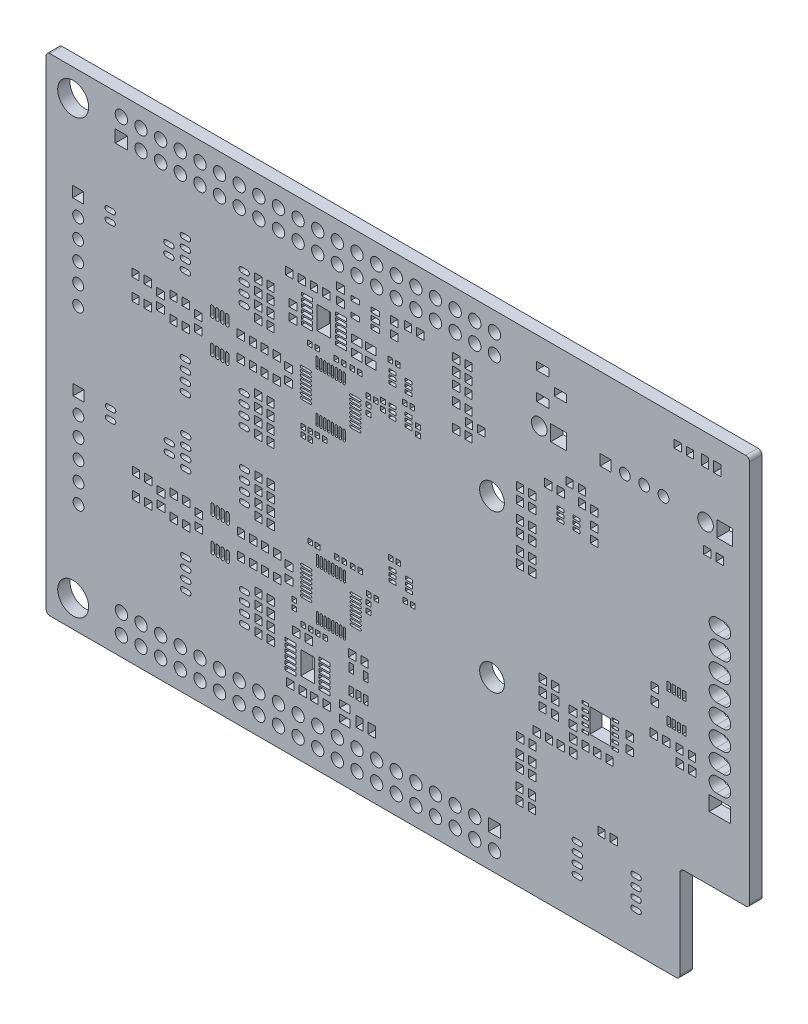
from build123d import *

# Parameters (mm, degrees)
MODEL_R            = 1.6
MODEL_R_2          = 0.7
MODEL_R_3          = 2
MODEL_R_4          = 1.0125
MODEL_R_5          = 0.8
MODEL_W            = 0.85
MODEL_H            = 0.35
MODEL_W_2          = 2.7
MODEL_H_2          = 3.1
MODEL_W_3          = 0.45
MODEL_H_3          = 1.1
MODEL_W_4          = 2.794
MODEL_H_4          = 1.905
MODEL_W_5          = 1.6
MODEL_H_5          = 1
MODEL_W_6          = 1.425
MODEL_H_6          = 0.45
MODEL_W_7          = 1.753
MODEL_H_7          = 2.947
MODEL_W_8          = 0.6
MODEL_W_9          = 1.1
MODEL_H_8          = 0.6
MODEL_W_10         = 1.4
MODEL_H_9          = 1.4
MODEL_W_11         = 0.9
MODEL_H_10         = 0.4
MODEL_W_12         = 0.64
MODEL_H_11         = 0.59
MODEL_W_13         = 0.59
MODEL_H_12         = 0.64
MODEL_W_14         = 0.95
MODEL_W_15         = 1
MODEL_H_13         = 0.95
MODEL_W_16         = 1.35
MODEL_H_14         = 1.35
MODEL_W_17         = 2.025
MODEL_H_15         = 2.025
MODEL_H_16         = 1.6
BOSS_EXTRU_1_DEPTH = 1.6


with BuildPart() as part:
    # Model → Boss.-Extru.1 (new body)
    with BuildSketch(Plane.XY):
        with BuildLine():
            Line((0, 0.5), (0, 62.5))
            ThreePointArc((0, 62.5), (0.1464465, 62.8535535), (0.5, 63))
            Line((0.5, 63), (90.5, 63))
            ThreePointArc((90.5, 63), (90.8535535, 62.8535535), (91, 62.5))
            Line((91, 62.5), (91, 13))
            ThreePointArc((91, 13), (90.8535535, 12.6464465), (90.5, 12.5))
            Line((90.5, 12.5), (82.5, 12.5))
            ThreePointArc((82.5, 12.5), (82.1464465, 12.3535535), (82, 12))
            Line((82, 12), (82, 0.5))
            ThreePointArc((82, 0.5), (81.8535535, 0.1464465), (81.5, 0))
            Line((81.5, 0), (0.5, 0))
            ThreePointArc((0.5, 0), (0.1464465, 0.1464465), (0, 0.5))
        make_face()
        with Locations((57.68, 42.02)):
            Circle(MODEL_R, mode=Mode.SUBTRACT)
        with Locations((57.6877, 21.7181)):
            Circle(MODEL_R, mode=Mode.SUBTRACT)
        with Locations((4.19, 24.35)):
            Circle(MODEL_R_2, mode=Mode.SUBTRACT)
        with Locations((4.19, 21.85)):
            Circle(MODEL_R_2, mode=Mode.SUBTRACT)
        with Locations((4.19, 19.35)):
            Circle(MODEL_R_2, mode=Mode.SUBTRACT)
        with Locations((4.19, 16.85)):
            Circle(MODEL_R_2, mode=Mode.SUBTRACT)
        with Locations((4.19, 14.35)):
            Circle(MODEL_R_2, mode=Mode.SUBTRACT)
        with Locations((4.14, 46.52)):
            Circle(MODEL_R_2, mode=Mode.SUBTRACT)
        with Locations((4.14, 44.02)):
            Circle(MODEL_R_2, mode=Mode.SUBTRACT)
        with Locations((4.14, 41.52)):
            Circle(MODEL_R_2, mode=Mode.SUBTRACT)
        with Locations((4.14, 39.02)):
            Circle(MODEL_R_2, mode=Mode.SUBTRACT)
        with Locations((4.14, 36.52)):
            Circle(MODEL_R_2, mode=Mode.SUBTRACT)
        with Locations((3.5, 59.5)):
            Circle(MODEL_R_3, mode=Mode.SUBTRACT)
        with Locations((3.5, 3.5)):
            Circle(MODEL_R_3, mode=Mode.SUBTRACT)
        with Locations((74.87, 53.09)):
            Circle(MODEL_R_2, mode=Mode.SUBTRACT)
        with Locations((77.37, 53.09)):
            Circle(MODEL_R_2, mode=Mode.SUBTRACT)
        with Locations((79.87, 53.09)):
            Circle(MODEL_R_2, mode=Mode.SUBTRACT)
        with Locations((85.31, 52.93)):
            Circle(MODEL_R_4, mode=Mode.SUBTRACT)
        with Locations((63.79, 52.92)):
            Circle(MODEL_R_4, mode=Mode.SUBTRACT)
        with Locations((58, 2.46)):
            Circle(MODEL_R_5, mode=Mode.SUBTRACT)
        with Locations((55.46, 5)):
            Circle(MODEL_R_5, mode=Mode.SUBTRACT)
        with Locations((55.46, 2.46)):
            Circle(MODEL_R_5, mode=Mode.SUBTRACT)
        with Locations((52.92, 5)):
            Circle(MODEL_R_5, mode=Mode.SUBTRACT)
        with Locations((52.92, 2.46)):
            Circle(MODEL_R_5, mode=Mode.SUBTRACT)
        with Locations((50.38, 5)):
            Circle(MODEL_R_5, mode=Mode.SUBTRACT)
        with Locations((50.38, 2.46)):
            Circle(MODEL_R_5, mode=Mode.SUBTRACT)
        with Locations((47.84, 5)):
            Circle(MODEL_R_5, mode=Mode.SUBTRACT)
        with Locations((47.84, 2.46)):
            Circle(MODEL_R_5, mode=Mode.SUBTRACT)
        with Locations((45.3, 5)):
            Circle(MODEL_R_5, mode=Mode.SUBTRACT)
        with Locations((45.3, 2.46)):
            Circle(MODEL_R_5, mode=Mode.SUBTRACT)
        with Locations((42.76, 5)):
            Circle(MODEL_R_5, mode=Mode.SUBTRACT)
        with Locations((42.76, 2.46)):
            Circle(MODEL_R_5, mode=Mode.SUBTRACT)
        with Locations((40.22, 5)):
            Circle(MODEL_R_5, mode=Mode.SUBTRACT)
        with Locations((40.22, 2.46)):
            Circle(MODEL_R_5, mode=Mode.SUBTRACT)
        with Locations((37.68, 5)):
            Circle(MODEL_R_5, mode=Mode.SUBTRACT)
        with Locations((37.68, 2.46)):
            Circle(MODEL_R_5, mode=Mode.SUBTRACT)
        with Locations((35.14, 5)):
            Circle(MODEL_R_5, mode=Mode.SUBTRACT)
        with Locations((35.14, 2.46)):
            Circle(MODEL_R_5, mode=Mode.SUBTRACT)
        with Locations((32.6, 5)):
            Circle(MODEL_R_5, mode=Mode.SUBTRACT)
        with Locations((32.6, 2.46)):
            Circle(MODEL_R_5, mode=Mode.SUBTRACT)
        with Locations((30.06, 5)):
            Circle(MODEL_R_5, mode=Mode.SUBTRACT)
        with Locations((30.06, 2.46)):
            Circle(MODEL_R_5, mode=Mode.SUBTRACT)
        with Locations((27.52, 5)):
            Circle(MODEL_R_5, mode=Mode.SUBTRACT)
        with Locations((27.52, 2.46)):
            Circle(MODEL_R_5, mode=Mode.SUBTRACT)
        with Locations((24.98, 5)):
            Circle(MODEL_R_5, mode=Mode.SUBTRACT)
        with Locations((24.98, 2.46)):
            Circle(MODEL_R_5, mode=Mode.SUBTRACT)
        with Locations((22.44, 5)):
            Circle(MODEL_R_5, mode=Mode.SUBTRACT)
        with Locations((22.44, 2.46)):
            Circle(MODEL_R_5, mode=Mode.SUBTRACT)
        with Locations((19.9, 5)):
            Circle(MODEL_R_5, mode=Mode.SUBTRACT)
        with Locations((19.9, 2.46)):
            Circle(MODEL_R_5, mode=Mode.SUBTRACT)
        with Locations((17.36, 5)):
            Circle(MODEL_R_5, mode=Mode.SUBTRACT)
        with Locations((17.36, 2.46)):
            Circle(MODEL_R_5, mode=Mode.SUBTRACT)
        with Locations((14.82, 5)):
            Circle(MODEL_R_5, mode=Mode.SUBTRACT)
        with Locations((14.82, 2.46)):
            Circle(MODEL_R_5, mode=Mode.SUBTRACT)
        with Locations((12.28, 5)):
            Circle(MODEL_R_5, mode=Mode.SUBTRACT)
        with Locations((12.28, 2.46)):
            Circle(MODEL_R_5, mode=Mode.SUBTRACT)
        with Locations((9.74, 5)):
            Circle(MODEL_R_5, mode=Mode.SUBTRACT)
        with Locations((9.74, 2.46)):
            Circle(MODEL_R_5, mode=Mode.SUBTRACT)
        with Locations((9.74, 60.54)):
            Circle(MODEL_R_5, mode=Mode.SUBTRACT)
        with Locations((12.28, 58)):
            Circle(MODEL_R_5, mode=Mode.SUBTRACT)
        with Locations((12.28, 60.54)):
            Circle(MODEL_R_5, mode=Mode.SUBTRACT)
        with Locations((14.82, 58)):
            Circle(MODEL_R_5, mode=Mode.SUBTRACT)
        with Locations((14.82, 60.54)):
            Circle(MODEL_R_5, mode=Mode.SUBTRACT)
        with Locations((17.36, 58)):
            Circle(MODEL_R_5, mode=Mode.SUBTRACT)
        with Locations((17.36, 60.54)):
            Circle(MODEL_R_5, mode=Mode.SUBTRACT)
        with Locations((19.9, 58)):
            Circle(MODEL_R_5, mode=Mode.SUBTRACT)
        with Locations((19.9, 60.54)):
            Circle(MODEL_R_5, mode=Mode.SUBTRACT)
        with Locations((22.44, 58)):
            Circle(MODEL_R_5, mode=Mode.SUBTRACT)
        with Locations((22.44, 60.54)):
            Circle(MODEL_R_5, mode=Mode.SUBTRACT)
        with Locations((24.98, 58)):
            Circle(MODEL_R_5, mode=Mode.SUBTRACT)
        with Locations((24.98, 60.54)):
            Circle(MODEL_R_5, mode=Mode.SUBTRACT)
        with Locations((27.52, 58)):
            Circle(MODEL_R_5, mode=Mode.SUBTRACT)
        with Locations((27.52, 60.54)):
            Circle(MODEL_R_5, mode=Mode.SUBTRACT)
        with Locations((30.06, 58)):
            Circle(MODEL_R_5, mode=Mode.SUBTRACT)
        with Locations((30.06, 60.54)):
            Circle(MODEL_R_5, mode=Mode.SUBTRACT)
        with Locations((32.6, 58)):
            Circle(MODEL_R_5, mode=Mode.SUBTRACT)
        with Locations((32.6, 60.54)):
            Circle(MODEL_R_5, mode=Mode.SUBTRACT)
        with Locations((35.14, 58)):
            Circle(MODEL_R_5, mode=Mode.SUBTRACT)
        with Locations((35.14, 60.54)):
            Circle(MODEL_R_5, mode=Mode.SUBTRACT)
        with Locations((37.68, 58)):
            Circle(MODEL_R_5, mode=Mode.SUBTRACT)
        with Locations((37.68, 60.54)):
            Circle(MODEL_R_5, mode=Mode.SUBTRACT)
        with Locations((40.22, 58)):
            Circle(MODEL_R_5, mode=Mode.SUBTRACT)
        with Locations((40.22, 60.54)):
            Circle(MODEL_R_5, mode=Mode.SUBTRACT)
        with Locations((42.76, 58)):
            Circle(MODEL_R_5, mode=Mode.SUBTRACT)
        with Locations((42.76, 60.54)):
            Circle(MODEL_R_5, mode=Mode.SUBTRACT)
        with Locations((45.3, 58)):
            Circle(MODEL_R_5, mode=Mode.SUBTRACT)
        with Locations((45.3, 60.54)):
            Circle(MODEL_R_5, mode=Mode.SUBTRACT)
        with Locations((47.84, 58)):
            Circle(MODEL_R_5, mode=Mode.SUBTRACT)
        with Locations((47.84, 60.54)):
            Circle(MODEL_R_5, mode=Mode.SUBTRACT)
        with Locations((50.38, 58)):
            Circle(MODEL_R_5, mode=Mode.SUBTRACT)
        with Locations((50.38, 60.54)):
            Circle(MODEL_R_5, mode=Mode.SUBTRACT)
        with Locations((52.92, 58)):
            Circle(MODEL_R_5, mode=Mode.SUBTRACT)
        with Locations((52.92, 60.54)):
            Circle(MODEL_R_5, mode=Mode.SUBTRACT)
        with Locations((55.46, 58)):
            Circle(MODEL_R_5, mode=Mode.SUBTRACT)
        with Locations((55.46, 60.54)):
            Circle(MODEL_R_5, mode=Mode.SUBTRACT)
        with Locations((58, 58)):
            Circle(MODEL_R_5, mode=Mode.SUBTRACT)
        with Locations((58, 60.54)):
            Circle(MODEL_R_5, mode=Mode.SUBTRACT)
        with Locations((69.74, 24.82)):
            Rectangle(MODEL_W, MODEL_H, mode=Mode.SUBTRACT)
        with Locations((69.74, 24.02)):
            Rectangle(MODEL_W, MODEL_H, mode=Mode.SUBTRACT)
        with Locations((69.74, 23.22)):
            Rectangle(MODEL_W, MODEL_H, mode=Mode.SUBTRACT)
        with Locations((69.74, 22.42)):
            Rectangle(MODEL_W, MODEL_H, mode=Mode.SUBTRACT)
        with Locations((69.74, 21.62)):
            Rectangle(MODEL_W, MODEL_H, mode=Mode.SUBTRACT)
        with Locations((73.64, 21.62)):
            Rectangle(MODEL_W, MODEL_H, mode=Mode.SUBTRACT)
        with Locations((73.64, 22.42)):
            Rectangle(MODEL_W, MODEL_H, mode=Mode.SUBTRACT)
        with Locations((73.64, 23.22)):
            Rectangle(MODEL_W, MODEL_H, mode=Mode.SUBTRACT)
        with Locations((73.64, 24.02)):
            Rectangle(MODEL_W, MODEL_H, mode=Mode.SUBTRACT)
        with Locations((73.64, 24.82)):
            Rectangle(MODEL_W, MODEL_H, mode=Mode.SUBTRACT)
        with Locations((71.69, 23.22)):
            Rectangle(MODEL_W_2, MODEL_H_2, mode=Mode.SUBTRACT)
        with Locations((82.525, 32.09)):
            Rectangle(MODEL_W_3, MODEL_H_3, mode=Mode.SUBTRACT)
        with Locations((81.875, 32.09)):
            Rectangle(MODEL_W_3, MODEL_H_3, mode=Mode.SUBTRACT)
        with Locations((81.225, 32.09)):
            Rectangle(MODEL_W_3, MODEL_H_3, mode=Mode.SUBTRACT)
        with Locations((80.575, 32.09)):
            Rectangle(MODEL_W_3, MODEL_H_3, mode=Mode.SUBTRACT)
        with Locations((80.575, 28.19)):
            Rectangle(MODEL_W_3, MODEL_H_3, mode=Mode.SUBTRACT)
        with Locations((81.225, 28.19)):
            Rectangle(MODEL_W_3, MODEL_H_3, mode=Mode.SUBTRACT)
        with Locations((81.875, 28.19)):
            Rectangle(MODEL_W_3, MODEL_H_3, mode=Mode.SUBTRACT)
        with Locations((82.525, 28.19)):
            Rectangle(MODEL_W_3, MODEL_H_3, mode=Mode.SUBTRACT)
        with Locations((87.17, 21.69)):
            Rectangle(MODEL_W_4, MODEL_H_4, mode=Mode.SUBTRACT)
        with BuildLine():
            Line((86.7255, 25.1825), (87.6145, 25.1825))
            ThreePointArc((87.6145, 25.1825), (88.567, 24.23), (87.6145, 23.2775))
            Line((87.6145, 23.2775), (86.7255, 23.2775))
            ThreePointArc((86.7255, 23.2775), (85.773, 24.23), (86.7255, 25.1825))
        make_face(mode=Mode.SUBTRACT)
        with BuildLine():
            Line((86.7255, 27.7225), (87.6145, 27.7225))
            ThreePointArc((87.6145, 27.7225), (88.567, 26.77), (87.6145, 25.8175))
            Line((87.6145, 25.8175), (86.7255, 25.8175))
            ThreePointArc((86.7255, 25.8175), (85.773, 26.77), (86.7255, 27.7225))
        make_face(mode=Mode.SUBTRACT)
        with BuildLine():
            Line((86.7255, 30.2625), (87.6145, 30.2625))
            ThreePointArc((87.6145, 30.2625), (88.567, 29.31), (87.6145, 28.3575))
            Line((87.6145, 28.3575), (86.7255, 28.3575))
            ThreePointArc((86.7255, 28.3575), (85.773, 29.31), (86.7255, 30.2625))
        make_face(mode=Mode.SUBTRACT)
        with BuildLine():
            Line((86.7255, 32.8025), (87.6145, 32.8025))
            ThreePointArc((87.6145, 32.8025), (88.567, 31.85), (87.6145, 30.8975))
            Line((87.6145, 30.8975), (86.7255, 30.8975))
            ThreePointArc((86.7255, 30.8975), (85.773, 31.85), (86.7255, 32.8025))
        make_face(mode=Mode.SUBTRACT)
        with BuildLine():
            Line((86.7255, 35.3425), (87.6145, 35.3425))
            ThreePointArc((87.6145, 35.3425), (88.567, 34.39), (87.6145, 33.4375))
            Line((87.6145, 33.4375), (86.7255, 33.4375))
            ThreePointArc((86.7255, 33.4375), (85.773, 34.39), (86.7255, 35.3425))
        make_face(mode=Mode.SUBTRACT)
        with BuildLine():
            Line((86.7255, 37.8825), (87.6145, 37.8825))
            ThreePointArc((87.6145, 37.8825), (88.567, 36.93), (87.6145, 35.9775))
            Line((87.6145, 35.9775), (86.7255, 35.9775))
            ThreePointArc((86.7255, 35.9775), (85.773, 36.93), (86.7255, 37.8825))
        make_face(mode=Mode.SUBTRACT)
        with BuildLine():
            Line((86.7255, 40.4225), (87.6145, 40.4225))
            ThreePointArc((87.6145, 40.4225), (88.567, 39.47), (87.6145, 38.5175))
            Line((87.6145, 38.5175), (86.7255, 38.5175))
            ThreePointArc((86.7255, 38.5175), (85.773, 39.47), (86.7255, 40.4225))
        make_face(mode=Mode.SUBTRACT)
        with BuildLine():
            Line((86.7255, 42.9625), (87.6145, 42.9625))
            ThreePointArc((87.6145, 42.9625), (88.567, 42.01), (87.6145, 41.0575))
            Line((87.6145, 41.0575), (86.7255, 41.0575))
            ThreePointArc((86.7255, 41.0575), (85.773, 42.01), (86.7255, 42.9625))
        make_face(mode=Mode.SUBTRACT)
        with Locations((64.2437, 59.5107)):
            Rectangle(MODEL_W_5, MODEL_H_5, mode=Mode.SUBTRACT)
        with Locations((66.5437, 57.7607)):
            Rectangle(MODEL_W_5, MODEL_H_5, mode=Mode.SUBTRACT)
        with Locations((64.2537, 56.0107)):
            Rectangle(MODEL_W_5, MODEL_H_5, mode=Mode.SUBTRACT)
        with Locations((31.618, 12.615)):
            Rectangle(MODEL_W_6, MODEL_H_6, mode=Mode.SUBTRACT)
        with Locations((31.618, 11.965)):
            Rectangle(MODEL_W_6, MODEL_H_6, mode=Mode.SUBTRACT)
        with Locations((31.618, 11.315)):
            Rectangle(MODEL_W_6, MODEL_H_6, mode=Mode.SUBTRACT)
        with Locations((31.618, 10.665)):
            Rectangle(MODEL_W_6, MODEL_H_6, mode=Mode.SUBTRACT)
        with Locations((31.618, 10.015)):
            Rectangle(MODEL_W_6, MODEL_H_6, mode=Mode.SUBTRACT)
        with Locations((31.618, 9.365)):
            Rectangle(MODEL_W_6, MODEL_H_6, mode=Mode.SUBTRACT)
        with Locations((36.042, 9.365)):
            Rectangle(MODEL_W_6, MODEL_H_6, mode=Mode.SUBTRACT)
        with Locations((36.042, 10.015)):
            Rectangle(MODEL_W_6, MODEL_H_6, mode=Mode.SUBTRACT)
        with Locations((36.042, 10.665)):
            Rectangle(MODEL_W_6, MODEL_H_6, mode=Mode.SUBTRACT)
        with Locations((36.042, 11.315)):
            Rectangle(MODEL_W_6, MODEL_H_6, mode=Mode.SUBTRACT)
        with Locations((36.042, 11.965)):
            Rectangle(MODEL_W_6, MODEL_H_6, mode=Mode.SUBTRACT)
        with Locations((36.042, 12.615)):
            Rectangle(MODEL_W_6, MODEL_H_6, mode=Mode.SUBTRACT)
        with Locations((33.83, 10.99)):
            Rectangle(MODEL_W_7, MODEL_H_7, mode=Mode.SUBTRACT)
        with Locations((38.152, 49.095)):
            Rectangle(MODEL_W_6, MODEL_H_6, mode=Mode.SUBTRACT)
        with Locations((38.152, 49.745)):
            Rectangle(MODEL_W_6, MODEL_H_6, mode=Mode.SUBTRACT)
        with Locations((38.152, 50.395)):
            Rectangle(MODEL_W_6, MODEL_H_6, mode=Mode.SUBTRACT)
        with Locations((38.152, 51.045)):
            Rectangle(MODEL_W_6, MODEL_H_6, mode=Mode.SUBTRACT)
        with Locations((38.152, 51.695)):
            Rectangle(MODEL_W_6, MODEL_H_6, mode=Mode.SUBTRACT)
        with Locations((38.152, 52.345)):
            Rectangle(MODEL_W_6, MODEL_H_6, mode=Mode.SUBTRACT)
        with Locations((33.728, 52.345)):
            Rectangle(MODEL_W_6, MODEL_H_6, mode=Mode.SUBTRACT)
        with Locations((33.728, 51.695)):
            Rectangle(MODEL_W_6, MODEL_H_6, mode=Mode.SUBTRACT)
        with Locations((33.728, 51.045)):
            Rectangle(MODEL_W_6, MODEL_H_6, mode=Mode.SUBTRACT)
        with Locations((33.728, 50.395)):
            Rectangle(MODEL_W_6, MODEL_H_6, mode=Mode.SUBTRACT)
        with Locations((33.728, 49.745)):
            Rectangle(MODEL_W_6, MODEL_H_6, mode=Mode.SUBTRACT)
        with Locations((33.728, 49.095)):
            Rectangle(MODEL_W_6, MODEL_H_6, mode=Mode.SUBTRACT)
        with Locations((35.94, 50.72)):
            Rectangle(MODEL_W_7, MODEL_H_7, mode=Mode.SUBTRACT)
        with Locations((39.4669, 11.0224)):
            Rectangle(MODEL_W_8, MODEL_H_3, mode=Mode.SUBTRACT)
        with Locations((40.4169, 11.0224)):
            Rectangle(MODEL_W_8, MODEL_H_3, mode=Mode.SUBTRACT)
        with Locations((41.3669, 11.0224)):
            Rectangle(MODEL_W_8, MODEL_H_3, mode=Mode.SUBTRACT)
        with Locations((41.3669, 13.6224)):
            Rectangle(MODEL_W_8, MODEL_H_3, mode=Mode.SUBTRACT)
        with Locations((39.4669, 13.6224)):
            Rectangle(MODEL_W_8, MODEL_H_3, mode=Mode.SUBTRACT)
        with Locations((42.57, 53.22)):
            Rectangle(MODEL_W_9, MODEL_H_8, mode=Mode.SUBTRACT)
        with Locations((42.57, 54.17)):
            Rectangle(MODEL_W_9, MODEL_H_8, mode=Mode.SUBTRACT)
        with Locations((42.57, 55.12)):
            Rectangle(MODEL_W_9, MODEL_H_8, mode=Mode.SUBTRACT)
        with Locations((39.97, 55.12)):
            Rectangle(MODEL_W_9, MODEL_H_8, mode=Mode.SUBTRACT)
        with Locations((39.97, 53.22)):
            Rectangle(MODEL_W_9, MODEL_H_8, mode=Mode.SUBTRACT)
        with BuildLine():
            Line((18.42, 15.04), (17.72, 15.04))
            ThreePointArc((17.72, 15.04), (17.395, 15.365), (17.72, 15.69))
            Line((17.72, 15.69), (18.42, 15.69))
            ThreePointArc((18.42, 15.69), (18.745, 15.365), (18.42, 15.04))
        make_face(mode=Mode.SUBTRACT)
        with BuildLine():
            Line((18.42, 13.77), (17.72, 13.77))
            ThreePointArc((17.72, 13.77), (17.395, 14.095), (17.72, 14.42))
            Line((17.72, 14.42), (18.42, 14.42))
            ThreePointArc((18.42, 14.42), (18.745, 14.095), (18.42, 13.77))
        make_face(mode=Mode.SUBTRACT)
        with BuildLine():
            Line((18.42, 12.5), (17.72, 12.5))
            ThreePointArc((17.72, 12.5), (17.395, 12.825), (17.72, 13.15))
            Line((17.72, 13.15), (18.42, 13.15))
            ThreePointArc((18.42, 13.15), (18.745, 12.825), (18.42, 12.5))
        make_face(mode=Mode.SUBTRACT)
        with BuildLine():
            Line((18.42, 11.23), (17.72, 11.23))
            ThreePointArc((17.72, 11.23), (17.395, 11.555), (17.72, 11.88))
            Line((17.72, 11.88), (18.42, 11.88))
            ThreePointArc((18.42, 11.88), (18.745, 11.555), (18.42, 11.23))
        make_face(mode=Mode.SUBTRACT)
        with BuildLine():
            Line((26.02, 11.23), (25.32, 11.23))
            ThreePointArc((25.32, 11.23), (24.995, 11.555), (25.32, 11.88))
            Line((25.32, 11.88), (26.02, 11.88))
            ThreePointArc((26.02, 11.88), (26.345, 11.555), (26.02, 11.23))
        make_face(mode=Mode.SUBTRACT)
        with BuildLine():
            Line((26.02, 12.5), (25.32, 12.5))
            ThreePointArc((25.32, 12.5), (24.995, 12.825), (25.32, 13.15))
            Line((25.32, 13.15), (26.02, 13.15))
            ThreePointArc((26.02, 13.15), (26.345, 12.825), (26.02, 12.5))
        make_face(mode=Mode.SUBTRACT)
        with BuildLine():
            Line((26.02, 13.77), (25.32, 13.77))
            ThreePointArc((25.32, 13.77), (24.995, 14.095), (25.32, 14.42))
            Line((25.32, 14.42), (26.02, 14.42))
            ThreePointArc((26.02, 14.42), (26.345, 14.095), (26.02, 13.77))
        make_face(mode=Mode.SUBTRACT)
        with BuildLine():
            Line((26.02, 15.04), (25.32, 15.04))
            ThreePointArc((25.32, 15.04), (24.995, 15.365), (25.32, 15.69))
            Line((25.32, 15.69), (26.02, 15.69))
            ThreePointArc((26.02, 15.69), (26.345, 15.365), (26.02, 15.04))
        make_face(mode=Mode.SUBTRACT)
        with BuildLine():
            Line((18.42, 28.7), (17.72, 28.7))
            ThreePointArc((17.72, 28.7), (17.395, 29.025), (17.72, 29.35))
            Line((17.72, 29.35), (18.42, 29.35))
            ThreePointArc((18.42, 29.35), (18.745, 29.025), (18.42, 28.7))
        make_face(mode=Mode.SUBTRACT)
        with BuildLine():
            Line((18.42, 27.43), (17.72, 27.43))
            ThreePointArc((17.72, 27.43), (17.395, 27.755), (17.72, 28.08))
            Line((17.72, 28.08), (18.42, 28.08))
            ThreePointArc((18.42, 28.08), (18.745, 27.755), (18.42, 27.43))
        make_face(mode=Mode.SUBTRACT)
        with BuildLine():
            Line((18.42, 26.16), (17.72, 26.16))
            ThreePointArc((17.72, 26.16), (17.395, 26.485), (17.72, 26.81))
            Line((17.72, 26.81), (18.42, 26.81))
            ThreePointArc((18.42, 26.81), (18.745, 26.485), (18.42, 26.16))
        make_face(mode=Mode.SUBTRACT)
        with BuildLine():
            Line((18.42, 24.89), (17.72, 24.89))
            ThreePointArc((17.72, 24.89), (17.395, 25.215), (17.72, 25.54))
            Line((17.72, 25.54), (18.42, 25.54))
            ThreePointArc((18.42, 25.54), (18.745, 25.215), (18.42, 24.89))
        make_face(mode=Mode.SUBTRACT)
        with BuildLine():
            Line((26.02, 24.89), (25.32, 24.89))
            ThreePointArc((25.32, 24.89), (24.995, 25.215), (25.32, 25.54))
            Line((25.32, 25.54), (26.02, 25.54))
            ThreePointArc((26.02, 25.54), (26.345, 25.215), (26.02, 24.89))
        make_face(mode=Mode.SUBTRACT)
        with BuildLine():
            Line((26.02, 26.16), (25.32, 26.16))
            ThreePointArc((25.32, 26.16), (24.995, 26.485), (25.32, 26.81))
            Line((25.32, 26.81), (26.02, 26.81))
            ThreePointArc((26.02, 26.81), (26.345, 26.485), (26.02, 26.16))
        make_face(mode=Mode.SUBTRACT)
        with BuildLine():
            Line((26.02, 27.43), (25.32, 27.43))
            ThreePointArc((25.32, 27.43), (24.995, 27.755), (25.32, 28.08))
            Line((25.32, 28.08), (26.02, 28.08))
            ThreePointArc((26.02, 28.08), (26.345, 27.755), (26.02, 27.43))
        make_face(mode=Mode.SUBTRACT)
        with BuildLine():
            Line((26.02, 28.7), (25.32, 28.7))
            ThreePointArc((25.32, 28.7), (24.995, 29.025), (25.32, 29.35))
            Line((25.32, 29.35), (26.02, 29.35))
            ThreePointArc((26.02, 29.35), (26.345, 29.025), (26.02, 28.7))
        make_face(mode=Mode.SUBTRACT)
        with BuildLine():
            Line((18.37, 37.21), (17.67, 37.21))
            ThreePointArc((17.67, 37.21), (17.345, 37.535), (17.67, 37.86))
            Line((17.67, 37.86), (18.37, 37.86))
            ThreePointArc((18.37, 37.86), (18.695, 37.535), (18.37, 37.21))
        make_face(mode=Mode.SUBTRACT)
        with BuildLine():
            Line((18.37, 35.94), (17.67, 35.94))
            ThreePointArc((17.67, 35.94), (17.345, 36.265), (17.67, 36.59))
            Line((17.67, 36.59), (18.37, 36.59))
            ThreePointArc((18.37, 36.59), (18.695, 36.265), (18.37, 35.94))
        make_face(mode=Mode.SUBTRACT)
        with BuildLine():
            Line((18.37, 34.67), (17.67, 34.67))
            ThreePointArc((17.67, 34.67), (17.345, 34.995), (17.67, 35.32))
            Line((17.67, 35.32), (18.37, 35.32))
            ThreePointArc((18.37, 35.32), (18.695, 34.995), (18.37, 34.67))
        make_face(mode=Mode.SUBTRACT)
        with BuildLine():
            Line((18.37, 33.4), (17.67, 33.4))
            ThreePointArc((17.67, 33.4), (17.345, 33.725), (17.67, 34.05))
            Line((17.67, 34.05), (18.37, 34.05))
            ThreePointArc((18.37, 34.05), (18.695, 33.725), (18.37, 33.4))
        make_face(mode=Mode.SUBTRACT)
        with BuildLine():
            Line((25.97, 33.4), (25.27, 33.4))
            ThreePointArc((25.27, 33.4), (24.945, 33.725), (25.27, 34.05))
            Line((25.27, 34.05), (25.97, 34.05))
            ThreePointArc((25.97, 34.05), (26.295, 33.725), (25.97, 33.4))
        make_face(mode=Mode.SUBTRACT)
        with BuildLine():
            Line((25.97, 34.67), (25.27, 34.67))
            ThreePointArc((25.27, 34.67), (24.945, 34.995), (25.27, 35.32))
            Line((25.27, 35.32), (25.97, 35.32))
            ThreePointArc((25.97, 35.32), (26.295, 34.995), (25.97, 34.67))
        make_face(mode=Mode.SUBTRACT)
        with BuildLine():
            Line((25.97, 35.94), (25.27, 35.94))
            ThreePointArc((25.27, 35.94), (24.945, 36.265), (25.27, 36.59))
            Line((25.27, 36.59), (25.97, 36.59))
            ThreePointArc((25.97, 36.59), (26.295, 36.265), (25.97, 35.94))
        make_face(mode=Mode.SUBTRACT)
        with BuildLine():
            Line((25.97, 37.21), (25.27, 37.21))
            ThreePointArc((25.27, 37.21), (24.945, 37.535), (25.27, 37.86))
            Line((25.27, 37.86), (25.97, 37.86))
            ThreePointArc((25.97, 37.86), (26.295, 37.535), (25.97, 37.21))
        make_face(mode=Mode.SUBTRACT)
        with BuildLine():
            Line((18.37, 50.87), (17.67, 50.87))
            ThreePointArc((17.67, 50.87), (17.345, 51.195), (17.67, 51.52))
            Line((17.67, 51.52), (18.37, 51.52))
            ThreePointArc((18.37, 51.52), (18.695, 51.195), (18.37, 50.87))
        make_face(mode=Mode.SUBTRACT)
        with BuildLine():
            Line((18.37, 49.6), (17.67, 49.6))
            ThreePointArc((17.67, 49.6), (17.345, 49.925), (17.67, 50.25))
            Line((17.67, 50.25), (18.37, 50.25))
            ThreePointArc((18.37, 50.25), (18.695, 49.925), (18.37, 49.6))
        make_face(mode=Mode.SUBTRACT)
        with BuildLine():
            Line((18.37, 48.33), (17.67, 48.33))
            ThreePointArc((17.67, 48.33), (17.345, 48.655), (17.67, 48.98))
            Line((17.67, 48.98), (18.37, 48.98))
            ThreePointArc((18.37, 48.98), (18.695, 48.655), (18.37, 48.33))
        make_face(mode=Mode.SUBTRACT)
        with BuildLine():
            Line((18.37, 47.06), (17.67, 47.06))
            ThreePointArc((17.67, 47.06), (17.345, 47.385), (17.67, 47.71))
            Line((17.67, 47.71), (18.37, 47.71))
            ThreePointArc((18.37, 47.71), (18.695, 47.385), (18.37, 47.06))
        make_face(mode=Mode.SUBTRACT)
        with BuildLine():
            Line((25.97, 47.06), (25.27, 47.06))
            ThreePointArc((25.27, 47.06), (24.945, 47.385), (25.27, 47.71))
            Line((25.27, 47.71), (25.97, 47.71))
            ThreePointArc((25.97, 47.71), (26.295, 47.385), (25.97, 47.06))
        make_face(mode=Mode.SUBTRACT)
        with BuildLine():
            Line((25.97, 48.33), (25.27, 48.33))
            ThreePointArc((25.27, 48.33), (24.945, 48.655), (25.27, 48.98))
            Line((25.27, 48.98), (25.97, 48.98))
            ThreePointArc((25.97, 48.98), (26.295, 48.655), (25.97, 48.33))
        make_face(mode=Mode.SUBTRACT)
        with BuildLine():
            Line((25.97, 49.6), (25.27, 49.6))
            ThreePointArc((25.27, 49.6), (24.945, 49.925), (25.27, 50.25))
            Line((25.27, 50.25), (25.97, 50.25))
            ThreePointArc((25.97, 50.25), (26.295, 49.925), (25.97, 49.6))
        make_face(mode=Mode.SUBTRACT)
        with BuildLine():
            Line((25.97, 50.87), (25.27, 50.87))
            ThreePointArc((25.27, 50.87), (24.945, 51.195), (25.27, 51.52))
            Line((25.27, 51.52), (25.97, 51.52))
            ThreePointArc((25.97, 51.52), (26.295, 51.195), (25.97, 50.87))
        make_face(mode=Mode.SUBTRACT)
        with BuildLine():
            Line((69.07, 8.46), (68.37, 8.46))
            ThreePointArc((68.37, 8.46), (68.045, 8.785), (68.37, 9.11))
            Line((68.37, 9.11), (69.07, 9.11))
            ThreePointArc((69.07, 9.11), (69.395, 8.785), (69.07, 8.46))
        make_face(mode=Mode.SUBTRACT)
        with BuildLine():
            Line((69.07, 7.19), (68.37, 7.19))
            ThreePointArc((68.37, 7.19), (68.045, 7.515), (68.37, 7.84))
            Line((68.37, 7.84), (69.07, 7.84))
            ThreePointArc((69.07, 7.84), (69.395, 7.515), (69.07, 7.19))
        make_face(mode=Mode.SUBTRACT)
        with BuildLine():
            Line((69.07, 5.92), (68.37, 5.92))
            ThreePointArc((68.37, 5.92), (68.045, 6.245), (68.37, 6.57))
            Line((68.37, 6.57), (69.07, 6.57))
            ThreePointArc((69.07, 6.57), (69.395, 6.245), (69.07, 5.92))
        make_face(mode=Mode.SUBTRACT)
        with BuildLine():
            Line((69.07, 4.65), (68.37, 4.65))
            ThreePointArc((68.37, 4.65), (68.045, 4.975), (68.37, 5.3))
            Line((68.37, 5.3), (69.07, 5.3))
            ThreePointArc((69.07, 5.3), (69.395, 4.975), (69.07, 4.65))
        make_face(mode=Mode.SUBTRACT)
        with BuildLine():
            Line((76.67, 4.65), (75.97, 4.65))
            ThreePointArc((75.97, 4.65), (75.645, 4.975), (75.97, 5.3))
            Line((75.97, 5.3), (76.67, 5.3))
            ThreePointArc((76.67, 5.3), (76.995, 4.975), (76.67, 4.65))
        make_face(mode=Mode.SUBTRACT)
        with BuildLine():
            Line((76.67, 5.92), (75.97, 5.92))
            ThreePointArc((75.97, 5.92), (75.645, 6.245), (75.97, 6.57))
            Line((75.97, 6.57), (76.67, 6.57))
            ThreePointArc((76.67, 6.57), (76.995, 6.245), (76.67, 5.92))
        make_face(mode=Mode.SUBTRACT)
        with BuildLine():
            Line((76.67, 7.19), (75.97, 7.19))
            ThreePointArc((75.97, 7.19), (75.645, 7.515), (75.97, 7.84))
            Line((75.97, 7.84), (76.67, 7.84))
            ThreePointArc((76.67, 7.84), (76.995, 7.515), (76.67, 7.19))
        make_face(mode=Mode.SUBTRACT)
        with BuildLine():
            Line((76.67, 8.46), (75.97, 8.46))
            ThreePointArc((75.97, 8.46), (75.645, 8.785), (75.97, 9.11))
            Line((75.97, 9.11), (76.67, 9.11))
            ThreePointArc((76.67, 9.11), (76.995, 8.785), (76.67, 8.46))
        make_face(mode=Mode.SUBTRACT)
        with BuildLine():
            Line((34.225, 21.88), (33.075, 21.88))
            ThreePointArc((33.075, 21.88), (32.925, 22.03), (33.075, 22.18))
            Line((33.075, 22.18), (34.225, 22.18))
            ThreePointArc((34.225, 22.18), (34.375, 22.03), (34.225, 21.88))
        make_face(mode=Mode.SUBTRACT)
        with BuildLine():
            Line((34.225, 21.38), (33.075, 21.38))
            ThreePointArc((33.075, 21.38), (32.925, 21.53), (33.075, 21.68))
            Line((33.075, 21.68), (34.225, 21.68))
            ThreePointArc((34.225, 21.68), (34.375, 21.53), (34.225, 21.38))
        make_face(mode=Mode.SUBTRACT)
        with BuildLine():
            Line((34.225, 20.88), (33.075, 20.88))
            ThreePointArc((33.075, 20.88), (32.925, 21.03), (33.075, 21.18))
            Line((33.075, 21.18), (34.225, 21.18))
            ThreePointArc((34.225, 21.18), (34.375, 21.03), (34.225, 20.88))
        make_face(mode=Mode.SUBTRACT)
        with BuildLine():
            Line((34.225, 20.38), (33.075, 20.38))
            ThreePointArc((33.075, 20.38), (32.925, 20.53), (33.075, 20.68))
            Line((33.075, 20.68), (34.225, 20.68))
            ThreePointArc((34.225, 20.68), (34.375, 20.53), (34.225, 20.38))
        make_face(mode=Mode.SUBTRACT)
        with BuildLine():
            Line((34.225, 19.88), (33.075, 19.88))
            ThreePointArc((33.075, 19.88), (32.925, 20.03), (33.075, 20.18))
            Line((33.075, 20.18), (34.225, 20.18))
            ThreePointArc((34.225, 20.18), (34.375, 20.03), (34.225, 19.88))
        make_face(mode=Mode.SUBTRACT)
        with BuildLine():
            Line((34.225, 19.38), (33.075, 19.38))
            ThreePointArc((33.075, 19.38), (32.925, 19.53), (33.075, 19.68))
            Line((33.075, 19.68), (34.225, 19.68))
            ThreePointArc((34.225, 19.68), (34.375, 19.53), (34.225, 19.38))
        make_face(mode=Mode.SUBTRACT)
        with BuildLine():
            Line((34.225, 18.88), (33.075, 18.88))
            ThreePointArc((33.075, 18.88), (32.925, 19.03), (33.075, 19.18))
            Line((33.075, 19.18), (34.225, 19.18))
            ThreePointArc((34.225, 19.18), (34.375, 19.03), (34.225, 18.88))
        make_face(mode=Mode.SUBTRACT)
        with BuildLine():
            Line((34.225, 18.38), (33.075, 18.38))
            ThreePointArc((33.075, 18.38), (32.925, 18.53), (33.075, 18.68))
            Line((33.075, 18.68), (34.225, 18.68))
            ThreePointArc((34.225, 18.68), (34.375, 18.53), (34.225, 18.38))
        make_face(mode=Mode.SUBTRACT)
        with BuildLine():
            Line((35.25, 17.655), (35.25, 16.505))
            ThreePointArc((35.25, 16.505), (35.1, 16.355), (34.95, 16.505))
            Line((34.95, 16.505), (34.95, 17.655))
            ThreePointArc((34.95, 17.655), (35.1, 17.805), (35.25, 17.655))
        make_face(mode=Mode.SUBTRACT)
        with BuildLine():
            Line((35.75, 17.655), (35.75, 16.505))
            ThreePointArc((35.75, 16.505), (35.6, 16.355), (35.45, 16.505))
            Line((35.45, 16.505), (35.45, 17.655))
            ThreePointArc((35.45, 17.655), (35.6, 17.805), (35.75, 17.655))
        make_face(mode=Mode.SUBTRACT)
        with BuildLine():
            Line((36.25, 17.655), (36.25, 16.505))
            ThreePointArc((36.25, 16.505), (36.1, 16.355), (35.95, 16.505))
            Line((35.95, 16.505), (35.95, 17.655))
            ThreePointArc((35.95, 17.655), (36.1, 17.805), (36.25, 17.655))
        make_face(mode=Mode.SUBTRACT)
        with BuildLine():
            Line((36.75, 17.655), (36.75, 16.505))
            ThreePointArc((36.75, 16.505), (36.6, 16.355), (36.45, 16.505))
            Line((36.45, 16.505), (36.45, 17.655))
            ThreePointArc((36.45, 17.655), (36.6, 17.805), (36.75, 17.655))
        make_face(mode=Mode.SUBTRACT)
        with BuildLine():
            Line((37.25, 17.655), (37.25, 16.505))
            ThreePointArc((37.25, 16.505), (37.1, 16.355), (36.95, 16.505))
            Line((36.95, 16.505), (36.95, 17.655))
            ThreePointArc((36.95, 17.655), (37.1, 17.805), (37.25, 17.655))
        make_face(mode=Mode.SUBTRACT)
        with BuildLine():
            Line((37.75, 17.655), (37.75, 16.505))
            ThreePointArc((37.75, 16.505), (37.6, 16.355), (37.45, 16.505))
            Line((37.45, 16.505), (37.45, 17.655))
            ThreePointArc((37.45, 17.655), (37.6, 17.805), (37.75, 17.655))
        make_face(mode=Mode.SUBTRACT)
        with BuildLine():
            Line((38.25, 17.655), (38.25, 16.505))
            ThreePointArc((38.25, 16.505), (38.1, 16.355), (37.95, 16.505))
            Line((37.95, 16.505), (37.95, 17.655))
            ThreePointArc((37.95, 17.655), (38.1, 17.805), (38.25, 17.655))
        make_face(mode=Mode.SUBTRACT)
        with BuildLine():
            Line((38.75, 17.655), (38.75, 16.505))
            ThreePointArc((38.75, 16.505), (38.6, 16.355), (38.45, 16.505))
            Line((38.45, 16.505), (38.45, 17.655))
            ThreePointArc((38.45, 17.655), (38.6, 17.805), (38.75, 17.655))
        make_face(mode=Mode.SUBTRACT)
        with BuildLine():
            Line((40.625, 18.38), (39.475, 18.38))
            ThreePointArc((39.475, 18.38), (39.325, 18.53), (39.475, 18.68))
            Line((39.475, 18.68), (40.625, 18.68))
            ThreePointArc((40.625, 18.68), (40.775, 18.53), (40.625, 18.38))
        make_face(mode=Mode.SUBTRACT)
        with BuildLine():
            Line((40.625, 18.88), (39.475, 18.88))
            ThreePointArc((39.475, 18.88), (39.325, 19.03), (39.475, 19.18))
            Line((39.475, 19.18), (40.625, 19.18))
            ThreePointArc((40.625, 19.18), (40.775, 19.03), (40.625, 18.88))
        make_face(mode=Mode.SUBTRACT)
        with BuildLine():
            Line((40.625, 19.38), (39.475, 19.38))
            ThreePointArc((39.475, 19.38), (39.325, 19.53), (39.475, 19.68))
            Line((39.475, 19.68), (40.625, 19.68))
            ThreePointArc((40.625, 19.68), (40.775, 19.53), (40.625, 19.38))
        make_face(mode=Mode.SUBTRACT)
        with BuildLine():
            Line((40.625, 19.88), (39.475, 19.88))
            ThreePointArc((39.475, 19.88), (39.325, 20.03), (39.475, 20.18))
            Line((39.475, 20.18), (40.625, 20.18))
            ThreePointArc((40.625, 20.18), (40.775, 20.03), (40.625, 19.88))
        make_face(mode=Mode.SUBTRACT)
        with BuildLine():
            Line((40.625, 20.38), (39.475, 20.38))
            ThreePointArc((39.475, 20.38), (39.325, 20.53), (39.475, 20.68))
            Line((39.475, 20.68), (40.625, 20.68))
            ThreePointArc((40.625, 20.68), (40.775, 20.53), (40.625, 20.38))
        make_face(mode=Mode.SUBTRACT)
        with BuildLine():
            Line((40.625, 20.88), (39.475, 20.88))
            ThreePointArc((39.475, 20.88), (39.325, 21.03), (39.475, 21.18))
            Line((39.475, 21.18), (40.625, 21.18))
            ThreePointArc((40.625, 21.18), (40.775, 21.03), (40.625, 20.88))
        make_face(mode=Mode.SUBTRACT)
        with BuildLine():
            Line((40.625, 21.38), (39.475, 21.38))
            ThreePointArc((39.475, 21.38), (39.325, 21.53), (39.475, 21.68))
            Line((39.475, 21.68), (40.625, 21.68))
            ThreePointArc((40.625, 21.68), (40.775, 21.53), (40.625, 21.38))
        make_face(mode=Mode.SUBTRACT)
        with BuildLine():
            Line((40.625, 21.88), (39.475, 21.88))
            ThreePointArc((39.475, 21.88), (39.325, 22.03), (39.475, 22.18))
            Line((39.475, 22.18), (40.625, 22.18))
            ThreePointArc((40.625, 22.18), (40.775, 22.03), (40.625, 21.88))
        make_face(mode=Mode.SUBTRACT)
        with BuildLine():
            Line((38.75, 24.055), (38.75, 22.905))
            ThreePointArc((38.75, 22.905), (38.6, 22.755), (38.45, 22.905))
            Line((38.45, 22.905), (38.45, 24.055))
            ThreePointArc((38.45, 24.055), (38.6, 24.205), (38.75, 24.055))
        make_face(mode=Mode.SUBTRACT)
        with BuildLine():
            Line((38.25, 24.055), (38.25, 22.905))
            ThreePointArc((38.25, 22.905), (38.1, 22.755), (37.95, 22.905))
            Line((37.95, 22.905), (37.95, 24.055))
            ThreePointArc((37.95, 24.055), (38.1, 24.205), (38.25, 24.055))
        make_face(mode=Mode.SUBTRACT)
        with BuildLine():
            Line((37.75, 24.055), (37.75, 22.905))
            ThreePointArc((37.75, 22.905), (37.6, 22.755), (37.45, 22.905))
            Line((37.45, 22.905), (37.45, 24.055))
            ThreePointArc((37.45, 24.055), (37.6, 24.205), (37.75, 24.055))
        make_face(mode=Mode.SUBTRACT)
        with BuildLine():
            Line((37.25, 24.055), (37.25, 22.905))
            ThreePointArc((37.25, 22.905), (37.1, 22.755), (36.95, 22.905))
            Line((36.95, 22.905), (36.95, 24.055))
            ThreePointArc((36.95, 24.055), (37.1, 24.205), (37.25, 24.055))
        make_face(mode=Mode.SUBTRACT)
        with BuildLine():
            Line((36.75, 24.055), (36.75, 22.905))
            ThreePointArc((36.75, 22.905), (36.6, 22.755), (36.45, 22.905))
            Line((36.45, 22.905), (36.45, 24.055))
            ThreePointArc((36.45, 24.055), (36.6, 24.205), (36.75, 24.055))
        make_face(mode=Mode.SUBTRACT)
        with BuildLine():
            Line((36.25, 24.055), (36.25, 22.905))
            ThreePointArc((36.25, 22.905), (36.1, 22.755), (35.95, 22.905))
            Line((35.95, 22.905), (35.95, 24.055))
            ThreePointArc((35.95, 24.055), (36.1, 24.205), (36.25, 24.055))
        make_face(mode=Mode.SUBTRACT)
        with BuildLine():
            Line((35.75, 24.055), (35.75, 22.905))
            ThreePointArc((35.75, 22.905), (35.6, 22.755), (35.45, 22.905))
            Line((35.45, 22.905), (35.45, 24.055))
            ThreePointArc((35.45, 24.055), (35.6, 24.205), (35.75, 24.055))
        make_face(mode=Mode.SUBTRACT)
        with BuildLine():
            Line((35.25, 24.055), (35.25, 22.905))
            ThreePointArc((35.25, 22.905), (35.1, 22.755), (34.95, 22.905))
            Line((34.95, 22.905), (34.95, 24.055))
            ThreePointArc((34.95, 24.055), (35.1, 24.205), (35.25, 24.055))
        make_face(mode=Mode.SUBTRACT)
        with BuildLine():
            Line((34.175, 44.05), (33.025, 44.05))
            ThreePointArc((33.025, 44.05), (32.875, 44.2), (33.025, 44.35))
            Line((33.025, 44.35), (34.175, 44.35))
            ThreePointArc((34.175, 44.35), (34.325, 44.2), (34.175, 44.05))
        make_face(mode=Mode.SUBTRACT)
        with BuildLine():
            Line((34.175, 43.55), (33.025, 43.55))
            ThreePointArc((33.025, 43.55), (32.875, 43.7), (33.025, 43.85))
            Line((33.025, 43.85), (34.175, 43.85))
            ThreePointArc((34.175, 43.85), (34.325, 43.7), (34.175, 43.55))
        make_face(mode=Mode.SUBTRACT)
        with BuildLine():
            Line((34.175, 43.05), (33.025, 43.05))
            ThreePointArc((33.025, 43.05), (32.875, 43.2), (33.025, 43.35))
            Line((33.025, 43.35), (34.175, 43.35))
            ThreePointArc((34.175, 43.35), (34.325, 43.2), (34.175, 43.05))
        make_face(mode=Mode.SUBTRACT)
        with BuildLine():
            Line((34.175, 42.55), (33.025, 42.55))
            ThreePointArc((33.025, 42.55), (32.875, 42.7), (33.025, 42.85))
            Line((33.025, 42.85), (34.175, 42.85))
            ThreePointArc((34.175, 42.85), (34.325, 42.7), (34.175, 42.55))
        make_face(mode=Mode.SUBTRACT)
        with BuildLine():
            Line((34.175, 42.05), (33.025, 42.05))
            ThreePointArc((33.025, 42.05), (32.875, 42.2), (33.025, 42.35))
            Line((33.025, 42.35), (34.175, 42.35))
            ThreePointArc((34.175, 42.35), (34.325, 42.2), (34.175, 42.05))
        make_face(mode=Mode.SUBTRACT)
        with BuildLine():
            Line((34.175, 41.55), (33.025, 41.55))
            ThreePointArc((33.025, 41.55), (32.875, 41.7), (33.025, 41.85))
            Line((33.025, 41.85), (34.175, 41.85))
            ThreePointArc((34.175, 41.85), (34.325, 41.7), (34.175, 41.55))
        make_face(mode=Mode.SUBTRACT)
        with BuildLine():
            Line((34.175, 41.05), (33.025, 41.05))
            ThreePointArc((33.025, 41.05), (32.875, 41.2), (33.025, 41.35))
            Line((33.025, 41.35), (34.175, 41.35))
            ThreePointArc((34.175, 41.35), (34.325, 41.2), (34.175, 41.05))
        make_face(mode=Mode.SUBTRACT)
        with BuildLine():
            Line((34.175, 40.55), (33.025, 40.55))
            ThreePointArc((33.025, 40.55), (32.875, 40.7), (33.025, 40.85))
            Line((33.025, 40.85), (34.175, 40.85))
            ThreePointArc((34.175, 40.85), (34.325, 40.7), (34.175, 40.55))
        make_face(mode=Mode.SUBTRACT)
        with BuildLine():
            Line((35.2, 39.825), (35.2, 38.675))
            ThreePointArc((35.2, 38.675), (35.05, 38.525), (34.9, 38.675))
            Line((34.9, 38.675), (34.9, 39.825))
            ThreePointArc((34.9, 39.825), (35.05, 39.975), (35.2, 39.825))
        make_face(mode=Mode.SUBTRACT)
        with BuildLine():
            Line((35.7, 39.825), (35.7, 38.675))
            ThreePointArc((35.7, 38.675), (35.55, 38.525), (35.4, 38.675))
            Line((35.4, 38.675), (35.4, 39.825))
            ThreePointArc((35.4, 39.825), (35.55, 39.975), (35.7, 39.825))
        make_face(mode=Mode.SUBTRACT)
        with BuildLine():
            Line((36.2, 39.825), (36.2, 38.675))
            ThreePointArc((36.2, 38.675), (36.05, 38.525), (35.9, 38.675))
            Line((35.9, 38.675), (35.9, 39.825))
            ThreePointArc((35.9, 39.825), (36.05, 39.975), (36.2, 39.825))
        make_face(mode=Mode.SUBTRACT)
        with BuildLine():
            Line((36.7, 39.825), (36.7, 38.675))
            ThreePointArc((36.7, 38.675), (36.55, 38.525), (36.4, 38.675))
            Line((36.4, 38.675), (36.4, 39.825))
            ThreePointArc((36.4, 39.825), (36.55, 39.975), (36.7, 39.825))
        make_face(mode=Mode.SUBTRACT)
        with BuildLine():
            Line((37.2, 39.825), (37.2, 38.675))
            ThreePointArc((37.2, 38.675), (37.05, 38.525), (36.9, 38.675))
            Line((36.9, 38.675), (36.9, 39.825))
            ThreePointArc((36.9, 39.825), (37.05, 39.975), (37.2, 39.825))
        make_face(mode=Mode.SUBTRACT)
        with BuildLine():
            Line((37.7, 39.825), (37.7, 38.675))
            ThreePointArc((37.7, 38.675), (37.55, 38.525), (37.4, 38.675))
            Line((37.4, 38.675), (37.4, 39.825))
            ThreePointArc((37.4, 39.825), (37.55, 39.975), (37.7, 39.825))
        make_face(mode=Mode.SUBTRACT)
        with BuildLine():
            Line((38.2, 39.825), (38.2, 38.675))
            ThreePointArc((38.2, 38.675), (38.05, 38.525), (37.9, 38.675))
            Line((37.9, 38.675), (37.9, 39.825))
            ThreePointArc((37.9, 39.825), (38.05, 39.975), (38.2, 39.825))
        make_face(mode=Mode.SUBTRACT)
        with BuildLine():
            Line((38.7, 39.825), (38.7, 38.675))
            ThreePointArc((38.7, 38.675), (38.55, 38.525), (38.4, 38.675))
            Line((38.4, 38.675), (38.4, 39.825))
            ThreePointArc((38.4, 39.825), (38.55, 39.975), (38.7, 39.825))
        make_face(mode=Mode.SUBTRACT)
        with BuildLine():
            Line((40.575, 40.55), (39.425, 40.55))
            ThreePointArc((39.425, 40.55), (39.275, 40.7), (39.425, 40.85))
            Line((39.425, 40.85), (40.575, 40.85))
            ThreePointArc((40.575, 40.85), (40.725, 40.7), (40.575, 40.55))
        make_face(mode=Mode.SUBTRACT)
        with BuildLine():
            Line((40.575, 41.05), (39.425, 41.05))
            ThreePointArc((39.425, 41.05), (39.275, 41.2), (39.425, 41.35))
            Line((39.425, 41.35), (40.575, 41.35))
            ThreePointArc((40.575, 41.35), (40.725, 41.2), (40.575, 41.05))
        make_face(mode=Mode.SUBTRACT)
        with BuildLine():
            Line((40.575, 41.55), (39.425, 41.55))
            ThreePointArc((39.425, 41.55), (39.275, 41.7), (39.425, 41.85))
            Line((39.425, 41.85), (40.575, 41.85))
            ThreePointArc((40.575, 41.85), (40.725, 41.7), (40.575, 41.55))
        make_face(mode=Mode.SUBTRACT)
        with BuildLine():
            Line((40.575, 42.05), (39.425, 42.05))
            ThreePointArc((39.425, 42.05), (39.275, 42.2), (39.425, 42.35))
            Line((39.425, 42.35), (40.575, 42.35))
            ThreePointArc((40.575, 42.35), (40.725, 42.2), (40.575, 42.05))
        make_face(mode=Mode.SUBTRACT)
        with BuildLine():
            Line((40.575, 42.55), (39.425, 42.55))
            ThreePointArc((39.425, 42.55), (39.275, 42.7), (39.425, 42.85))
            Line((39.425, 42.85), (40.575, 42.85))
            ThreePointArc((40.575, 42.85), (40.725, 42.7), (40.575, 42.55))
        make_face(mode=Mode.SUBTRACT)
        with BuildLine():
            Line((40.575, 43.05), (39.425, 43.05))
            ThreePointArc((39.425, 43.05), (39.275, 43.2), (39.425, 43.35))
            Line((39.425, 43.35), (40.575, 43.35))
            ThreePointArc((40.575, 43.35), (40.725, 43.2), (40.575, 43.05))
        make_face(mode=Mode.SUBTRACT)
        with BuildLine():
            Line((40.575, 43.55), (39.425, 43.55))
            ThreePointArc((39.425, 43.55), (39.275, 43.7), (39.425, 43.85))
            Line((39.425, 43.85), (40.575, 43.85))
            ThreePointArc((40.575, 43.85), (40.725, 43.7), (40.575, 43.55))
        make_face(mode=Mode.SUBTRACT)
        with BuildLine():
            Line((40.575, 44.05), (39.425, 44.05))
            ThreePointArc((39.425, 44.05), (39.275, 44.2), (39.425, 44.35))
            Line((39.425, 44.35), (40.575, 44.35))
            ThreePointArc((40.575, 44.35), (40.725, 44.2), (40.575, 44.05))
        make_face(mode=Mode.SUBTRACT)
        with BuildLine():
            Line((38.7, 46.225), (38.7, 45.075))
            ThreePointArc((38.7, 45.075), (38.55, 44.925), (38.4, 45.075))
            Line((38.4, 45.075), (38.4, 46.225))
            ThreePointArc((38.4, 46.225), (38.55, 46.375), (38.7, 46.225))
        make_face(mode=Mode.SUBTRACT)
        with BuildLine():
            Line((38.2, 46.225), (38.2, 45.075))
            ThreePointArc((38.2, 45.075), (38.05, 44.925), (37.9, 45.075))
            Line((37.9, 45.075), (37.9, 46.225))
            ThreePointArc((37.9, 46.225), (38.05, 46.375), (38.2, 46.225))
        make_face(mode=Mode.SUBTRACT)
        with BuildLine():
            Line((37.7, 46.225), (37.7, 45.075))
            ThreePointArc((37.7, 45.075), (37.55, 44.925), (37.4, 45.075))
            Line((37.4, 45.075), (37.4, 46.225))
            ThreePointArc((37.4, 46.225), (37.55, 46.375), (37.7, 46.225))
        make_face(mode=Mode.SUBTRACT)
        with BuildLine():
            Line((37.2, 46.225), (37.2, 45.075))
            ThreePointArc((37.2, 45.075), (37.05, 44.925), (36.9, 45.075))
            Line((36.9, 45.075), (36.9, 46.225))
            ThreePointArc((36.9, 46.225), (37.05, 46.375), (37.2, 46.225))
        make_face(mode=Mode.SUBTRACT)
        with BuildLine():
            Line((36.7, 46.225), (36.7, 45.075))
            ThreePointArc((36.7, 45.075), (36.55, 44.925), (36.4, 45.075))
            Line((36.4, 45.075), (36.4, 46.225))
            ThreePointArc((36.4, 46.225), (36.55, 46.375), (36.7, 46.225))
        make_face(mode=Mode.SUBTRACT)
        with BuildLine():
            Line((36.2, 46.225), (36.2, 45.075))
            ThreePointArc((36.2, 45.075), (36.05, 44.925), (35.9, 45.075))
            Line((35.9, 45.075), (35.9, 46.225))
            ThreePointArc((35.9, 46.225), (36.05, 46.375), (36.2, 46.225))
        make_face(mode=Mode.SUBTRACT)
        with BuildLine():
            Line((35.7, 46.225), (35.7, 45.075))
            ThreePointArc((35.7, 45.075), (35.55, 44.925), (35.4, 45.075))
            Line((35.4, 45.075), (35.4, 46.225))
            ThreePointArc((35.4, 46.225), (35.55, 46.375), (35.7, 46.225))
        make_face(mode=Mode.SUBTRACT)
        with BuildLine():
            Line((35.2, 46.225), (35.2, 45.075))
            ThreePointArc((35.2, 45.075), (35.05, 44.925), (34.9, 45.075))
            Line((34.9, 45.075), (34.9, 46.225))
            ThreePointArc((34.9, 46.225), (35.05, 46.375), (35.2, 46.225))
        make_face(mode=Mode.SUBTRACT)
        with BuildLine():
            Line((21.76, 18.655), (21.76, 17.605))
            ThreePointArc((21.76, 17.605), (21.535, 17.38), (21.31, 17.605))
            Line((21.31, 17.605), (21.31, 18.655))
            ThreePointArc((21.31, 18.655), (21.535, 18.88), (21.76, 18.655))
        make_face(mode=Mode.SUBTRACT)
        with BuildLine():
            Line((22.41, 18.655), (22.41, 17.605))
            ThreePointArc((22.41, 17.605), (22.185, 17.38), (21.96, 17.605))
            Line((21.96, 17.605), (21.96, 18.655))
            ThreePointArc((21.96, 18.655), (22.185, 18.88), (22.41, 18.655))
        make_face(mode=Mode.SUBTRACT)
        with BuildLine():
            Line((23.06, 18.655), (23.06, 17.605))
            ThreePointArc((23.06, 17.605), (22.835, 17.38), (22.61, 17.605))
            Line((22.61, 17.605), (22.61, 18.655))
            ThreePointArc((22.61, 18.655), (22.835, 18.88), (23.06, 18.655))
        make_face(mode=Mode.SUBTRACT)
        with BuildLine():
            Line((23.71, 18.655), (23.71, 17.605))
            ThreePointArc((23.71, 17.605), (23.485, 17.38), (23.26, 17.605))
            Line((23.26, 17.605), (23.26, 18.655))
            ThreePointArc((23.26, 18.655), (23.485, 18.88), (23.71, 18.655))
        make_face(mode=Mode.SUBTRACT)
        with BuildLine():
            Line((23.71, 22.955), (23.71, 21.905))
            ThreePointArc((23.71, 21.905), (23.485, 21.68), (23.26, 21.905))
            Line((23.26, 21.905), (23.26, 22.955))
            ThreePointArc((23.26, 22.955), (23.485, 23.18), (23.71, 22.955))
        make_face(mode=Mode.SUBTRACT)
        with BuildLine():
            Line((23.06, 22.955), (23.06, 21.905))
            ThreePointArc((23.06, 21.905), (22.835, 21.68), (22.61, 21.905))
            Line((22.61, 21.905), (22.61, 22.955))
            ThreePointArc((22.61, 22.955), (22.835, 23.18), (23.06, 22.955))
        make_face(mode=Mode.SUBTRACT)
        with BuildLine():
            Line((22.41, 22.955), (22.41, 21.905))
            ThreePointArc((22.41, 21.905), (22.185, 21.68), (21.96, 21.905))
            Line((21.96, 21.905), (21.96, 22.955))
            ThreePointArc((21.96, 22.955), (22.185, 23.18), (22.41, 22.955))
        make_face(mode=Mode.SUBTRACT)
        with BuildLine():
            Line((21.76, 22.955), (21.76, 21.905))
            ThreePointArc((21.76, 21.905), (21.535, 21.68), (21.31, 21.905))
            Line((21.31, 21.905), (21.31, 22.955))
            ThreePointArc((21.31, 22.955), (21.535, 23.18), (21.76, 22.955))
        make_face(mode=Mode.SUBTRACT)
        with BuildLine():
            Line((21.71, 40.825), (21.71, 39.775))
            ThreePointArc((21.71, 39.775), (21.485, 39.55), (21.26, 39.775))
            Line((21.26, 39.775), (21.26, 40.825))
            ThreePointArc((21.26, 40.825), (21.485, 41.05), (21.71, 40.825))
        make_face(mode=Mode.SUBTRACT)
        with BuildLine():
            Line((22.36, 40.825), (22.36, 39.775))
            ThreePointArc((22.36, 39.775), (22.135, 39.55), (21.91, 39.775))
            Line((21.91, 39.775), (21.91, 40.825))
            ThreePointArc((21.91, 40.825), (22.135, 41.05), (22.36, 40.825))
        make_face(mode=Mode.SUBTRACT)
        with BuildLine():
            Line((23.01, 40.825), (23.01, 39.775))
            ThreePointArc((23.01, 39.775), (22.785, 39.55), (22.56, 39.775))
            Line((22.56, 39.775), (22.56, 40.825))
            ThreePointArc((22.56, 40.825), (22.785, 41.05), (23.01, 40.825))
        make_face(mode=Mode.SUBTRACT)
        with BuildLine():
            Line((23.66, 40.825), (23.66, 39.775))
            ThreePointArc((23.66, 39.775), (23.435, 39.55), (23.21, 39.775))
            Line((23.21, 39.775), (23.21, 40.825))
            ThreePointArc((23.21, 40.825), (23.435, 41.05), (23.66, 40.825))
        make_face(mode=Mode.SUBTRACT)
        with BuildLine():
            Line((23.66, 45.125), (23.66, 44.075))
            ThreePointArc((23.66, 44.075), (23.435, 43.85), (23.21, 44.075))
            Line((23.21, 44.075), (23.21, 45.125))
            ThreePointArc((23.21, 45.125), (23.435, 45.35), (23.66, 45.125))
        make_face(mode=Mode.SUBTRACT)
        with BuildLine():
            Line((23.01, 45.125), (23.01, 44.075))
            ThreePointArc((23.01, 44.075), (22.785, 43.85), (22.56, 44.075))
            Line((22.56, 44.075), (22.56, 45.125))
            ThreePointArc((22.56, 45.125), (22.785, 45.35), (23.01, 45.125))
        make_face(mode=Mode.SUBTRACT)
        with BuildLine():
            Line((22.36, 45.125), (22.36, 44.075))
            ThreePointArc((22.36, 44.075), (22.135, 43.85), (21.91, 44.075))
            Line((21.91, 44.075), (21.91, 45.125))
            ThreePointArc((21.91, 45.125), (22.135, 45.35), (22.36, 45.125))
        make_face(mode=Mode.SUBTRACT)
        with BuildLine():
            Line((21.71, 45.125), (21.71, 44.075))
            ThreePointArc((21.71, 44.075), (21.485, 43.85), (21.26, 44.075))
            Line((21.26, 44.075), (21.26, 45.125))
            ThreePointArc((21.26, 45.125), (21.485, 45.35), (21.71, 45.125))
        make_face(mode=Mode.SUBTRACT)
        with BuildLine():
            Line((8.69, 26.85), (7.99, 26.85))
            ThreePointArc((7.99, 26.85), (7.665, 27.175), (7.99, 27.5))
            Line((7.99, 27.5), (8.69, 27.5))
            ThreePointArc((8.69, 27.5), (9.015, 27.175), (8.69, 26.85))
        make_face(mode=Mode.SUBTRACT)
        with BuildLine():
            Line((8.69, 25.58), (7.99, 25.58))
            ThreePointArc((7.99, 25.58), (7.665, 25.905), (7.99, 26.23))
            Line((7.99, 26.23), (8.69, 26.23))
            ThreePointArc((8.69, 26.23), (9.015, 25.905), (8.69, 25.58))
        make_face(mode=Mode.SUBTRACT)
        with BuildLine():
            Line((16.29, 25.58), (15.59, 25.58))
            ThreePointArc((15.59, 25.58), (15.265, 25.905), (15.59, 26.23))
            Line((15.59, 26.23), (16.29, 26.23))
            ThreePointArc((16.29, 26.23), (16.615, 25.905), (16.29, 25.58))
        make_face(mode=Mode.SUBTRACT)
        with BuildLine():
            Line((16.29, 26.85), (15.59, 26.85))
            ThreePointArc((15.59, 26.85), (15.265, 27.175), (15.59, 27.5))
            Line((15.59, 27.5), (16.29, 27.5))
            ThreePointArc((16.29, 27.5), (16.615, 27.175), (16.29, 26.85))
        make_face(mode=Mode.SUBTRACT)
        with BuildLine():
            Line((8.64, 49.02), (7.94, 49.02))
            ThreePointArc((7.94, 49.02), (7.615, 49.345), (7.94, 49.67))
            Line((7.94, 49.67), (8.64, 49.67))
            ThreePointArc((8.64, 49.67), (8.965, 49.345), (8.64, 49.02))
        make_face(mode=Mode.SUBTRACT)
        with BuildLine():
            Line((8.64, 47.75), (7.94, 47.75))
            ThreePointArc((7.94, 47.75), (7.615, 48.075), (7.94, 48.4))
            Line((7.94, 48.4), (8.64, 48.4))
            ThreePointArc((8.64, 48.4), (8.965, 48.075), (8.64, 47.75))
        make_face(mode=Mode.SUBTRACT)
        with BuildLine():
            Line((16.24, 47.75), (15.54, 47.75))
            ThreePointArc((15.54, 47.75), (15.215, 48.075), (15.54, 48.4))
            Line((15.54, 48.4), (16.24, 48.4))
            ThreePointArc((16.24, 48.4), (16.565, 48.075), (16.24, 47.75))
        make_face(mode=Mode.SUBTRACT)
        with BuildLine():
            Line((16.24, 49.02), (15.54, 49.02))
            ThreePointArc((15.54, 49.02), (15.215, 49.345), (15.54, 49.67))
            Line((15.54, 49.67), (16.24, 49.67))
            ThreePointArc((16.24, 49.67), (16.565, 49.345), (16.24, 49.02))
        make_face(mode=Mode.SUBTRACT)
        with Locations((4.19, 26.85)):
            Rectangle(MODEL_W_10, MODEL_H_9, mode=Mode.SUBTRACT)
        with Locations((4.14, 49.02)):
            Rectangle(MODEL_W_10, MODEL_H_9, mode=Mode.SUBTRACT)
        with Locations((66.53, 44.97)):
            Rectangle(MODEL_W_11, MODEL_H_10, mode=Mode.SUBTRACT)
        with Locations((66.53, 44.32)):
            Rectangle(MODEL_W_11, MODEL_H_10, mode=Mode.SUBTRACT)
        with Locations((66.53, 43.67)):
            Rectangle(MODEL_W_11, MODEL_H_10, mode=Mode.SUBTRACT)
        with Locations((68.63, 43.67)):
            Rectangle(MODEL_W_11, MODEL_H_10, mode=Mode.SUBTRACT)
        with Locations((68.63, 44.32)):
            Rectangle(MODEL_W_11, MODEL_H_10, mode=Mode.SUBTRACT)
        with Locations((68.63, 44.97)):
            Rectangle(MODEL_W_11, MODEL_H_10, mode=Mode.SUBTRACT)
        with Locations((44.84, 27.29)):
            Rectangle(MODEL_W_11, MODEL_H_10, mode=Mode.SUBTRACT)
        with Locations((44.84, 26.64)):
            Rectangle(MODEL_W_11, MODEL_H_10, mode=Mode.SUBTRACT)
        with Locations((44.84, 25.99)):
            Rectangle(MODEL_W_11, MODEL_H_10, mode=Mode.SUBTRACT)
        with Locations((46.94, 25.99)):
            Rectangle(MODEL_W_11, MODEL_H_10, mode=Mode.SUBTRACT)
        with Locations((46.94, 26.64)):
            Rectangle(MODEL_W_11, MODEL_H_10, mode=Mode.SUBTRACT)
        with Locations((46.94, 27.29)):
            Rectangle(MODEL_W_11, MODEL_H_10, mode=Mode.SUBTRACT)
        with Locations((44.79, 49.46)):
            Rectangle(MODEL_W_11, MODEL_H_10, mode=Mode.SUBTRACT)
        with Locations((44.79, 48.81)):
            Rectangle(MODEL_W_11, MODEL_H_10, mode=Mode.SUBTRACT)
        with Locations((44.79, 48.16)):
            Rectangle(MODEL_W_11, MODEL_H_10, mode=Mode.SUBTRACT)
        with Locations((46.89, 48.16)):
            Rectangle(MODEL_W_11, MODEL_H_10, mode=Mode.SUBTRACT)
        with Locations((46.89, 48.81)):
            Rectangle(MODEL_W_11, MODEL_H_10, mode=Mode.SUBTRACT)
        with Locations((46.89, 49.46)):
            Rectangle(MODEL_W_11, MODEL_H_10, mode=Mode.SUBTRACT)
        with Locations((44.79, 45.64)):
            Rectangle(MODEL_W_11, MODEL_H_10, mode=Mode.SUBTRACT)
        with Locations((44.79, 44.99)):
            Rectangle(MODEL_W_11, MODEL_H_10, mode=Mode.SUBTRACT)
        with Locations((44.79, 44.34)):
            Rectangle(MODEL_W_11, MODEL_H_10, mode=Mode.SUBTRACT)
        with Locations((46.89, 44.34)):
            Rectangle(MODEL_W_11, MODEL_H_10, mode=Mode.SUBTRACT)
        with Locations((46.89, 44.99)):
            Rectangle(MODEL_W_11, MODEL_H_10, mode=Mode.SUBTRACT)
        with Locations((46.89, 45.64)):
            Rectangle(MODEL_W_11, MODEL_H_10, mode=Mode.SUBTRACT)
        with Locations((32.1, 17.61)):
            Rectangle(MODEL_W_12, MODEL_H_11, mode=Mode.SUBTRACT)
        with Locations((32.1, 16.65)):
            Rectangle(MODEL_W_12, MODEL_H_11, mode=Mode.SUBTRACT)
        with Locations((33.29, 15.37)):
            Rectangle(MODEL_W_13, MODEL_H_12, mode=Mode.SUBTRACT)
        with Locations((34.25, 15.37)):
            Rectangle(MODEL_W_13, MODEL_H_12, mode=Mode.SUBTRACT)
        with Locations((33.24, 36.6)):
            Rectangle(MODEL_W_13, MODEL_H_12, mode=Mode.SUBTRACT)
        with Locations((34.2, 36.6)):
            Rectangle(MODEL_W_13, MODEL_H_12, mode=Mode.SUBTRACT)
        with Locations((33.24, 37.54)):
            Rectangle(MODEL_W_13, MODEL_H_12, mode=Mode.SUBTRACT)
        with Locations((34.2, 37.54)):
            Rectangle(MODEL_W_13, MODEL_H_12, mode=Mode.SUBTRACT)
        with Locations((45.55, 28.51)):
            Rectangle(MODEL_W_13, MODEL_H_12, mode=Mode.SUBTRACT)
        with Locations((44.59, 28.51)):
            Rectangle(MODEL_W_13, MODEL_H_12, mode=Mode.SUBTRACT)
        with Locations((46.46, 24.66)):
            Rectangle(MODEL_W_13, MODEL_H_12, mode=Mode.SUBTRACT)
        with Locations((47.42, 24.66)):
            Rectangle(MODEL_W_13, MODEL_H_12, mode=Mode.SUBTRACT)
        with Locations((35.15, 15.37)):
            Rectangle(MODEL_W_13, MODEL_H_12, mode=Mode.SUBTRACT)
        with Locations((36.11, 15.37)):
            Rectangle(MODEL_W_13, MODEL_H_12, mode=Mode.SUBTRACT)
        with Locations((41.74, 23.03)):
            Rectangle(MODEL_W_13, MODEL_H_12, mode=Mode.SUBTRACT)
        with Locations((42.7, 23.03)):
            Rectangle(MODEL_W_13, MODEL_H_12, mode=Mode.SUBTRACT)
        with Locations((41.73, 21.08)):
            Rectangle(MODEL_W_12, MODEL_H_11, mode=Mode.SUBTRACT)
        with Locations((41.73, 22.04)):
            Rectangle(MODEL_W_12, MODEL_H_11, mode=Mode.SUBTRACT)
        with Locations((40.62, 25.12)):
            Rectangle(MODEL_W_13, MODEL_H_12, mode=Mode.SUBTRACT)
        with Locations((39.66, 25.12)):
            Rectangle(MODEL_W_13, MODEL_H_12, mode=Mode.SUBTRACT)
        with Locations((38.56, 25.13)):
            Rectangle(MODEL_W_13, MODEL_H_12, mode=Mode.SUBTRACT)
        with Locations((37.6, 25.13)):
            Rectangle(MODEL_W_13, MODEL_H_12, mode=Mode.SUBTRACT)
        with Locations((34.15, 25.12)):
            Rectangle(MODEL_W_13, MODEL_H_12, mode=Mode.SUBTRACT)
        with Locations((35.11, 25.12)):
            Rectangle(MODEL_W_13, MODEL_H_12, mode=Mode.SUBTRACT)
        with Locations((45.5, 50.68)):
            Rectangle(MODEL_W_13, MODEL_H_12, mode=Mode.SUBTRACT)
        with Locations((44.54, 50.68)):
            Rectangle(MODEL_W_13, MODEL_H_12, mode=Mode.SUBTRACT)
        with Locations((46.41, 46.83)):
            Rectangle(MODEL_W_13, MODEL_H_12, mode=Mode.SUBTRACT)
        with Locations((47.37, 46.83)):
            Rectangle(MODEL_W_13, MODEL_H_12, mode=Mode.SUBTRACT)
        with Locations((41.69, 45.2)):
            Rectangle(MODEL_W_13, MODEL_H_12, mode=Mode.SUBTRACT)
        with Locations((42.65, 45.2)):
            Rectangle(MODEL_W_13, MODEL_H_12, mode=Mode.SUBTRACT)
        with Locations((41.68, 43.25)):
            Rectangle(MODEL_W_12, MODEL_H_11, mode=Mode.SUBTRACT)
        with Locations((41.68, 44.21)):
            Rectangle(MODEL_W_12, MODEL_H_11, mode=Mode.SUBTRACT)
        with Locations((35.1, 37.54)):
            Rectangle(MODEL_W_13, MODEL_H_12, mode=Mode.SUBTRACT)
        with Locations((36.06, 37.54)):
            Rectangle(MODEL_W_13, MODEL_H_12, mode=Mode.SUBTRACT)
        with Locations((40.57, 47.29)):
            Rectangle(MODEL_W_13, MODEL_H_12, mode=Mode.SUBTRACT)
        with Locations((39.61, 47.29)):
            Rectangle(MODEL_W_13, MODEL_H_12, mode=Mode.SUBTRACT)
        with Locations((34.1, 47.29)):
            Rectangle(MODEL_W_13, MODEL_H_12, mode=Mode.SUBTRACT)
        with Locations((35.06, 47.29)):
            Rectangle(MODEL_W_13, MODEL_H_12, mode=Mode.SUBTRACT)
        with Locations((38.51, 47.3)):
            Rectangle(MODEL_W_13, MODEL_H_12, mode=Mode.SUBTRACT)
        with Locations((37.55, 47.3)):
            Rectangle(MODEL_W_13, MODEL_H_12, mode=Mode.SUBTRACT)
        with Locations((48.09, 45.04)):
            Rectangle(MODEL_W_12, MODEL_H_11, mode=Mode.SUBTRACT)
        with Locations((48.09, 44.08)):
            Rectangle(MODEL_W_12, MODEL_H_11, mode=Mode.SUBTRACT)
        with Locations((43.58, 44.66)):
            Rectangle(MODEL_W_12, MODEL_H_11, mode=Mode.SUBTRACT)
        with Locations((43.58, 45.62)):
            Rectangle(MODEL_W_12, MODEL_H_11, mode=Mode.SUBTRACT)
        with Locations((87.15, 49.7)):
            Rectangle(MODEL_W_14, MODEL_H_5, mode=Mode.SUBTRACT)
        with Locations((85.55, 49.7)):
            Rectangle(MODEL_W_14, MODEL_H_5, mode=Mode.SUBTRACT)
        with Locations((66.5787, 18.5001)):
            Rectangle(MODEL_W_14, MODEL_H_5, mode=Mode.SUBTRACT)
        with Locations((68.1787, 18.5001)):
            Rectangle(MODEL_W_14, MODEL_H_5, mode=Mode.SUBTRACT)
        with Locations((63.465, 18.4975)):
            Rectangle(MODEL_W_14, MODEL_H_5, mode=Mode.SUBTRACT)
        with Locations((65.065, 18.4975)):
            Rectangle(MODEL_W_14, MODEL_H_5, mode=Mode.SUBTRACT)
        with Locations((71.2837, 20.0525)):
            Rectangle(MODEL_W_14, MODEL_H_5, mode=Mode.SUBTRACT)
        with Locations((72.8837, 20.0525)):
            Rectangle(MODEL_W_14, MODEL_H_5, mode=Mode.SUBTRACT)
        with Locations((69.7778, 20.0524)):
            Rectangle(MODEL_W_14, MODEL_H_5, mode=Mode.SUBTRACT)
        with Locations((68.1778, 20.0524)):
            Rectangle(MODEL_W_14, MODEL_H_5, mode=Mode.SUBTRACT)
        with Locations((68.1778, 23.1578)):
            Rectangle(MODEL_W_15, MODEL_H_13, mode=Mode.SUBTRACT)
        with Locations((68.1778, 21.5578)):
            Rectangle(MODEL_W_15, MODEL_H_13, mode=Mode.SUBTRACT)
        with Locations((64.2274, 21.57)):
            Rectangle(MODEL_W_14, MODEL_H_5, mode=Mode.SUBTRACT)
        with Locations((65.8274, 21.57)):
            Rectangle(MODEL_W_14, MODEL_H_5, mode=Mode.SUBTRACT)
        with Locations((64.27, 23.28)):
            Rectangle(MODEL_W_14, MODEL_H_5, mode=Mode.SUBTRACT)
        with Locations((65.87, 23.28)):
            Rectangle(MODEL_W_14, MODEL_H_5, mode=Mode.SUBTRACT)
        with Locations((75.52, 22.41)):
            Rectangle(MODEL_W_15, MODEL_H_13, mode=Mode.SUBTRACT)
        with Locations((75.52, 24.01)):
            Rectangle(MODEL_W_15, MODEL_H_13, mode=Mode.SUBTRACT)
        with Locations((64.27, 24.78)):
            Rectangle(MODEL_W_14, MODEL_H_5, mode=Mode.SUBTRACT)
        with Locations((65.87, 24.78)):
            Rectangle(MODEL_W_14, MODEL_H_5, mode=Mode.SUBTRACT)
        with Locations((67.72, 48.53)):
            Rectangle(MODEL_W_14, MODEL_H_5, mode=Mode.SUBTRACT)
        with Locations((69.32, 48.53)):
            Rectangle(MODEL_W_14, MODEL_H_5, mode=Mode.SUBTRACT)
        with Locations((70.92, 46.97)):
            Rectangle(MODEL_W_14, MODEL_H_5, mode=Mode.SUBTRACT)
        with Locations((69.32, 46.97)):
            Rectangle(MODEL_W_14, MODEL_H_5, mode=Mode.SUBTRACT)
        with Locations((70.9, 45.17)):
            Rectangle(MODEL_W_15, MODEL_H_13, mode=Mode.SUBTRACT)
        with Locations((70.9, 43.57)):
            Rectangle(MODEL_W_15, MODEL_H_13, mode=Mode.SUBTRACT)
        with Locations((66.57, 46.95)):
            Rectangle(MODEL_W_14, MODEL_H_5, mode=Mode.SUBTRACT)
        with Locations((64.97, 46.95)):
            Rectangle(MODEL_W_14, MODEL_H_5, mode=Mode.SUBTRACT)
        with Locations((61.25, 9.62)):
            Rectangle(MODEL_W_14, MODEL_H_5, mode=Mode.SUBTRACT)
        with Locations((62.85, 9.62)):
            Rectangle(MODEL_W_14, MODEL_H_5, mode=Mode.SUBTRACT)
        with Locations((61.25, 11.12)):
            Rectangle(MODEL_W_14, MODEL_H_5, mode=Mode.SUBTRACT)
        with Locations((62.85, 11.12)):
            Rectangle(MODEL_W_14, MODEL_H_5, mode=Mode.SUBTRACT)
        with Locations((61.28, 13.33)):
            Rectangle(MODEL_W_14, MODEL_H_5, mode=Mode.SUBTRACT)
        with Locations((62.88, 13.33)):
            Rectangle(MODEL_W_14, MODEL_H_5, mode=Mode.SUBTRACT)
        with Locations((61.28, 14.83)):
            Rectangle(MODEL_W_14, MODEL_H_5, mode=Mode.SUBTRACT)
        with Locations((62.88, 14.83)):
            Rectangle(MODEL_W_14, MODEL_H_5, mode=Mode.SUBTRACT)
        with Locations((61.3278, 16.7599)):
            Rectangle(MODEL_W_14, MODEL_H_5, mode=Mode.SUBTRACT)
        with Locations((62.9278, 16.7599)):
            Rectangle(MODEL_W_14, MODEL_H_5, mode=Mode.SUBTRACT)
        with Locations((80.23, 25.81)):
            Rectangle(MODEL_W_14, MODEL_H_5, mode=Mode.SUBTRACT)
        with Locations((78.63, 25.81)):
            Rectangle(MODEL_W_14, MODEL_H_5, mode=Mode.SUBTRACT)
        with Locations((81.95, 25.81)):
            Rectangle(MODEL_W_14, MODEL_H_5, mode=Mode.SUBTRACT)
        with Locations((83.55, 25.81)):
            Rectangle(MODEL_W_14, MODEL_H_5, mode=Mode.SUBTRACT)
        with Locations((81.99, 24.17)):
            Rectangle(MODEL_W_14, MODEL_H_5, mode=Mode.SUBTRACT)
        with Locations((83.59, 24.17)):
            Rectangle(MODEL_W_14, MODEL_H_5, mode=Mode.SUBTRACT)
        with Locations((78.75, 31.09)):
            Rectangle(MODEL_W_15, MODEL_H_13, mode=Mode.SUBTRACT)
        with Locations((78.75, 29.49)):
            Rectangle(MODEL_W_15, MODEL_H_13, mode=Mode.SUBTRACT)
        with Locations((36.31, 7.91)):
            Rectangle(MODEL_W_14, MODEL_H_5, mode=Mode.SUBTRACT)
        with Locations((34.71, 7.91)):
            Rectangle(MODEL_W_14, MODEL_H_5, mode=Mode.SUBTRACT)
        with Locations((45.05, 53.65)):
            Rectangle(MODEL_W_15, MODEL_H_13, mode=Mode.SUBTRACT)
        with Locations((45.05, 55.25)):
            Rectangle(MODEL_W_15, MODEL_H_13, mode=Mode.SUBTRACT)
        with Locations((32.36, 14.11)):
            Rectangle(MODEL_W_14, MODEL_H_5, mode=Mode.SUBTRACT)
        with Locations((33.96, 14.11)):
            Rectangle(MODEL_W_14, MODEL_H_5, mode=Mode.SUBTRACT)
        with Locations((31.46, 53.95)):
            Rectangle(MODEL_W_14, MODEL_H_5, mode=Mode.SUBTRACT)
        with Locations((33.06, 53.95)):
            Rectangle(MODEL_W_14, MODEL_H_5, mode=Mode.SUBTRACT)
        with Locations((38.09, 53.93)):
            Rectangle(MODEL_W_15, MODEL_H_13, mode=Mode.SUBTRACT)
        with Locations((38.09, 55.53)):
            Rectangle(MODEL_W_15, MODEL_H_13, mode=Mode.SUBTRACT)
        with Locations((34.65, 53.95)):
            Rectangle(MODEL_W_14, MODEL_H_5, mode=Mode.SUBTRACT)
        with Locations((36.25, 53.95)):
            Rectangle(MODEL_W_14, MODEL_H_5, mode=Mode.SUBTRACT)
        with Locations((33.18, 7.91)):
            Rectangle(MODEL_W_14, MODEL_H_5, mode=Mode.SUBTRACT)
        with Locations((31.58, 7.91)):
            Rectangle(MODEL_W_14, MODEL_H_5, mode=Mode.SUBTRACT)
        with Locations((39.5832, 15.1962)):
            Rectangle(MODEL_W_14, MODEL_H_5, mode=Mode.SUBTRACT)
        with Locations((41.1832, 15.1962)):
            Rectangle(MODEL_W_14, MODEL_H_5, mode=Mode.SUBTRACT)
        with Locations((31.9297, 50.5876)):
            Rectangle(MODEL_W_15, MODEL_H_13, mode=Mode.SUBTRACT)
        with Locations((31.9297, 48.9876)):
            Rectangle(MODEL_W_15, MODEL_H_13, mode=Mode.SUBTRACT)
        with Locations((27.48, 11.55)):
            Rectangle(MODEL_W_14, MODEL_H_5, mode=Mode.SUBTRACT)
        with Locations((29.08, 11.55)):
            Rectangle(MODEL_W_14, MODEL_H_5, mode=Mode.SUBTRACT)
        with Locations((27.48, 13.05)):
            Rectangle(MODEL_W_14, MODEL_H_5, mode=Mode.SUBTRACT)
        with Locations((29.08, 13.05)):
            Rectangle(MODEL_W_14, MODEL_H_5, mode=Mode.SUBTRACT)
        with Locations((27.48, 14.55)):
            Rectangle(MODEL_W_14, MODEL_H_5, mode=Mode.SUBTRACT)
        with Locations((29.08, 14.55)):
            Rectangle(MODEL_W_14, MODEL_H_5, mode=Mode.SUBTRACT)
        with Locations((27.48, 16.05)):
            Rectangle(MODEL_W_14, MODEL_H_5, mode=Mode.SUBTRACT)
        with Locations((29.08, 16.05)):
            Rectangle(MODEL_W_14, MODEL_H_5, mode=Mode.SUBTRACT)
        with Locations((27.48, 24.53)):
            Rectangle(MODEL_W_14, MODEL_H_5, mode=Mode.SUBTRACT)
        with Locations((29.08, 24.53)):
            Rectangle(MODEL_W_14, MODEL_H_5, mode=Mode.SUBTRACT)
        with Locations((27.48, 26.03)):
            Rectangle(MODEL_W_14, MODEL_H_5, mode=Mode.SUBTRACT)
        with Locations((29.08, 26.03)):
            Rectangle(MODEL_W_14, MODEL_H_5, mode=Mode.SUBTRACT)
        with Locations((27.48, 27.53)):
            Rectangle(MODEL_W_14, MODEL_H_5, mode=Mode.SUBTRACT)
        with Locations((29.08, 27.53)):
            Rectangle(MODEL_W_14, MODEL_H_5, mode=Mode.SUBTRACT)
        with Locations((27.48, 29.03)):
            Rectangle(MODEL_W_14, MODEL_H_5, mode=Mode.SUBTRACT)
        with Locations((29.08, 29.03)):
            Rectangle(MODEL_W_14, MODEL_H_5, mode=Mode.SUBTRACT)
        with Locations((31.41, 19.48)):
            Rectangle(MODEL_W_15, MODEL_H_13, mode=Mode.SUBTRACT)
        with Locations((31.41, 21.08)):
            Rectangle(MODEL_W_15, MODEL_H_13, mode=Mode.SUBTRACT)
        with Locations((28.31, 18.92)):
            Rectangle(MODEL_W_14, MODEL_H_5, mode=Mode.SUBTRACT)
        with Locations((29.91, 18.92)):
            Rectangle(MODEL_W_14, MODEL_H_5, mode=Mode.SUBTRACT)
        with Locations((28.31, 21.64)):
            Rectangle(MODEL_W_14, MODEL_H_5, mode=Mode.SUBTRACT)
        with Locations((29.91, 21.64)):
            Rectangle(MODEL_W_14, MODEL_H_5, mode=Mode.SUBTRACT)
        with Locations((25.21, 18.92)):
            Rectangle(MODEL_W_14, MODEL_H_5, mode=Mode.SUBTRACT)
        with Locations((26.81, 18.92)):
            Rectangle(MODEL_W_14, MODEL_H_5, mode=Mode.SUBTRACT)
        with Locations((25.21, 21.64)):
            Rectangle(MODEL_W_14, MODEL_H_5, mode=Mode.SUBTRACT)
        with Locations((26.81, 21.64)):
            Rectangle(MODEL_W_14, MODEL_H_5, mode=Mode.SUBTRACT)
        with Locations((19.74, 19.48)):
            Rectangle(MODEL_W_15, MODEL_H_13, mode=Mode.SUBTRACT)
        with Locations((19.74, 21.08)):
            Rectangle(MODEL_W_15, MODEL_H_13, mode=Mode.SUBTRACT)
        with Locations((16.53, 18.92)):
            Rectangle(MODEL_W_14, MODEL_H_5, mode=Mode.SUBTRACT)
        with Locations((18.13, 18.92)):
            Rectangle(MODEL_W_14, MODEL_H_5, mode=Mode.SUBTRACT)
        with Locations((16.53, 21.64)):
            Rectangle(MODEL_W_14, MODEL_H_5, mode=Mode.SUBTRACT)
        with Locations((18.13, 21.64)):
            Rectangle(MODEL_W_14, MODEL_H_5, mode=Mode.SUBTRACT)
        with Locations((14.85, 19.48)):
            Rectangle(MODEL_W_15, MODEL_H_13, mode=Mode.SUBTRACT)
        with Locations((14.85, 21.08)):
            Rectangle(MODEL_W_15, MODEL_H_13, mode=Mode.SUBTRACT)
        with Locations((13.22, 18.92)):
            Rectangle(MODEL_W_14, MODEL_H_5, mode=Mode.SUBTRACT)
        with Locations((11.62, 18.92)):
            Rectangle(MODEL_W_14, MODEL_H_5, mode=Mode.SUBTRACT)
        with Locations((13.22, 21.64)):
            Rectangle(MODEL_W_14, MODEL_H_5, mode=Mode.SUBTRACT)
        with Locations((11.62, 21.64)):
            Rectangle(MODEL_W_14, MODEL_H_5, mode=Mode.SUBTRACT)
        with Locations((27.43, 38.22)):
            Rectangle(MODEL_W_14, MODEL_H_5, mode=Mode.SUBTRACT)
        with Locations((29.03, 38.22)):
            Rectangle(MODEL_W_14, MODEL_H_5, mode=Mode.SUBTRACT)
        with Locations((27.43, 36.72)):
            Rectangle(MODEL_W_14, MODEL_H_5, mode=Mode.SUBTRACT)
        with Locations((29.03, 36.72)):
            Rectangle(MODEL_W_14, MODEL_H_5, mode=Mode.SUBTRACT)
        with Locations((27.43, 35.22)):
            Rectangle(MODEL_W_14, MODEL_H_5, mode=Mode.SUBTRACT)
        with Locations((29.03, 35.22)):
            Rectangle(MODEL_W_14, MODEL_H_5, mode=Mode.SUBTRACT)
        with Locations((27.43, 33.72)):
            Rectangle(MODEL_W_14, MODEL_H_5, mode=Mode.SUBTRACT)
        with Locations((29.03, 33.72)):
            Rectangle(MODEL_W_14, MODEL_H_5, mode=Mode.SUBTRACT)
        with Locations((27.43, 46.7)):
            Rectangle(MODEL_W_14, MODEL_H_5, mode=Mode.SUBTRACT)
        with Locations((29.03, 46.7)):
            Rectangle(MODEL_W_14, MODEL_H_5, mode=Mode.SUBTRACT)
        with Locations((27.43, 48.2)):
            Rectangle(MODEL_W_14, MODEL_H_5, mode=Mode.SUBTRACT)
        with Locations((29.03, 48.2)):
            Rectangle(MODEL_W_14, MODEL_H_5, mode=Mode.SUBTRACT)
        with Locations((27.43, 49.7)):
            Rectangle(MODEL_W_14, MODEL_H_5, mode=Mode.SUBTRACT)
        with Locations((29.03, 49.7)):
            Rectangle(MODEL_W_14, MODEL_H_5, mode=Mode.SUBTRACT)
        with Locations((27.43, 51.2)):
            Rectangle(MODEL_W_14, MODEL_H_5, mode=Mode.SUBTRACT)
        with Locations((29.03, 51.2)):
            Rectangle(MODEL_W_14, MODEL_H_5, mode=Mode.SUBTRACT)
        with Locations((31.36, 41.65)):
            Rectangle(MODEL_W_15, MODEL_H_13, mode=Mode.SUBTRACT)
        with Locations((31.36, 43.25)):
            Rectangle(MODEL_W_15, MODEL_H_13, mode=Mode.SUBTRACT)
        with Locations((28.26, 41.09)):
            Rectangle(MODEL_W_14, MODEL_H_5, mode=Mode.SUBTRACT)
        with Locations((29.86, 41.09)):
            Rectangle(MODEL_W_14, MODEL_H_5, mode=Mode.SUBTRACT)
        with Locations((28.26, 43.81)):
            Rectangle(MODEL_W_14, MODEL_H_5, mode=Mode.SUBTRACT)
        with Locations((29.86, 43.81)):
            Rectangle(MODEL_W_14, MODEL_H_5, mode=Mode.SUBTRACT)
        with Locations((25.16, 41.09)):
            Rectangle(MODEL_W_14, MODEL_H_5, mode=Mode.SUBTRACT)
        with Locations((26.76, 41.09)):
            Rectangle(MODEL_W_14, MODEL_H_5, mode=Mode.SUBTRACT)
        with Locations((25.16, 43.81)):
            Rectangle(MODEL_W_14, MODEL_H_5, mode=Mode.SUBTRACT)
        with Locations((26.76, 43.81)):
            Rectangle(MODEL_W_14, MODEL_H_5, mode=Mode.SUBTRACT)
        with Locations((19.69, 41.65)):
            Rectangle(MODEL_W_15, MODEL_H_13, mode=Mode.SUBTRACT)
        with Locations((19.69, 43.25)):
            Rectangle(MODEL_W_15, MODEL_H_13, mode=Mode.SUBTRACT)
        with Locations((14.8, 41.65)):
            Rectangle(MODEL_W_15, MODEL_H_13, mode=Mode.SUBTRACT)
        with Locations((14.8, 43.25)):
            Rectangle(MODEL_W_15, MODEL_H_13, mode=Mode.SUBTRACT)
        with Locations((16.48, 41.09)):
            Rectangle(MODEL_W_14, MODEL_H_5, mode=Mode.SUBTRACT)
        with Locations((18.08, 41.09)):
            Rectangle(MODEL_W_14, MODEL_H_5, mode=Mode.SUBTRACT)
        with Locations((16.48, 43.81)):
            Rectangle(MODEL_W_14, MODEL_H_5, mode=Mode.SUBTRACT)
        with Locations((18.08, 43.81)):
            Rectangle(MODEL_W_14, MODEL_H_5, mode=Mode.SUBTRACT)
        with Locations((13.17, 41.09)):
            Rectangle(MODEL_W_14, MODEL_H_5, mode=Mode.SUBTRACT)
        with Locations((11.57, 41.09)):
            Rectangle(MODEL_W_14, MODEL_H_5, mode=Mode.SUBTRACT)
        with Locations((13.17, 43.81)):
            Rectangle(MODEL_W_14, MODEL_H_5, mode=Mode.SUBTRACT)
        with Locations((11.57, 43.81)):
            Rectangle(MODEL_W_14, MODEL_H_5, mode=Mode.SUBTRACT)
        with Locations((81.7, 59.68)):
            Rectangle(MODEL_W_14, MODEL_H_5, mode=Mode.SUBTRACT)
        with Locations((83.3, 59.68)):
            Rectangle(MODEL_W_14, MODEL_H_5, mode=Mode.SUBTRACT)
        with Locations((73.4455, 11.4112)):
            Rectangle(MODEL_W_14, MODEL_H_5, mode=Mode.SUBTRACT)
        with Locations((71.8455, 11.4112)):
            Rectangle(MODEL_W_14, MODEL_H_5, mode=Mode.SUBTRACT)
        with Locations((46.81, 55.56)):
            Rectangle(MODEL_W_14, MODEL_H_5, mode=Mode.SUBTRACT)
        with Locations((48.41, 55.56)):
            Rectangle(MODEL_W_14, MODEL_H_5, mode=Mode.SUBTRACT)
        with Locations((53.04, 55.1)):
            Rectangle(MODEL_W_14, MODEL_H_5, mode=Mode.SUBTRACT)
        with Locations((54.64, 55.1)):
            Rectangle(MODEL_W_14, MODEL_H_5, mode=Mode.SUBTRACT)
        with Locations((53.04, 53.56)):
            Rectangle(MODEL_W_14, MODEL_H_5, mode=Mode.SUBTRACT)
        with Locations((54.64, 53.56)):
            Rectangle(MODEL_W_14, MODEL_H_5, mode=Mode.SUBTRACT)
        with Locations((53.04, 50.15)):
            Rectangle(MODEL_W_14, MODEL_H_5, mode=Mode.SUBTRACT)
        with Locations((54.64, 50.15)):
            Rectangle(MODEL_W_14, MODEL_H_5, mode=Mode.SUBTRACT)
        with Locations((56.3, 48.65)):
            Rectangle(MODEL_W_14, MODEL_H_5, mode=Mode.SUBTRACT)
        with Locations((54.7, 48.65)):
            Rectangle(MODEL_W_14, MODEL_H_5, mode=Mode.SUBTRACT)
        with Locations((53.04, 52.02)):
            Rectangle(MODEL_W_14, MODEL_H_5, mode=Mode.SUBTRACT)
        with Locations((54.64, 52.02)):
            Rectangle(MODEL_W_14, MODEL_H_5, mode=Mode.SUBTRACT)
        with Locations((61.31, 36.12)):
            Rectangle(MODEL_W_14, MODEL_H_5, mode=Mode.SUBTRACT)
        with Locations((62.91, 36.12)):
            Rectangle(MODEL_W_14, MODEL_H_5, mode=Mode.SUBTRACT)
        with Locations((61.31, 39.62)):
            Rectangle(MODEL_W_14, MODEL_H_5, mode=Mode.SUBTRACT)
        with Locations((62.91, 39.62)):
            Rectangle(MODEL_W_14, MODEL_H_5, mode=Mode.SUBTRACT)
        with Locations((61.3, 43.26)):
            Rectangle(MODEL_W_14, MODEL_H_5, mode=Mode.SUBTRACT)
        with Locations((62.9, 43.26)):
            Rectangle(MODEL_W_14, MODEL_H_5, mode=Mode.SUBTRACT)
        with Locations((53.04, 47.15)):
            Rectangle(MODEL_W_14, MODEL_H_5, mode=Mode.SUBTRACT)
        with Locations((54.64, 47.15)):
            Rectangle(MODEL_W_14, MODEL_H_5, mode=Mode.SUBTRACT)
        with Locations((61.3022, 44.7766)):
            Rectangle(MODEL_W_14, MODEL_H_5, mode=Mode.SUBTRACT)
        with Locations((62.9022, 44.7766)):
            Rectangle(MODEL_W_14, MODEL_H_5, mode=Mode.SUBTRACT)
        with Locations((61.31, 41.12)):
            Rectangle(MODEL_W_14, MODEL_H_5, mode=Mode.SUBTRACT)
        with Locations((62.91, 41.12)):
            Rectangle(MODEL_W_14, MODEL_H_5, mode=Mode.SUBTRACT)
        with Locations((61.31, 37.62)):
            Rectangle(MODEL_W_14, MODEL_H_5, mode=Mode.SUBTRACT)
        with Locations((62.91, 37.62)):
            Rectangle(MODEL_W_14, MODEL_H_5, mode=Mode.SUBTRACT)
        with Locations((38.6387, 8.9022)):
            Rectangle(MODEL_W_16, MODEL_H_13, mode=Mode.SUBTRACT)
        with Locations((38.6387, 7.3022)):
            Rectangle(MODEL_W_16, MODEL_H_13, mode=Mode.SUBTRACT)
        with Locations((40.5451, 8.0145)):
            Rectangle(MODEL_W_14, MODEL_H_14, mode=Mode.SUBTRACT)
        with Locations((42.1451, 8.0145)):
            Rectangle(MODEL_W_14, MODEL_H_14, mode=Mode.SUBTRACT)
        with Locations((42.0122, 50.6759)):
            Rectangle(MODEL_W_16, MODEL_H_13, mode=Mode.SUBTRACT)
        with Locations((42.0122, 49.0759)):
            Rectangle(MODEL_W_16, MODEL_H_13, mode=Mode.SUBTRACT)
        with Locations((40.1786, 50.6601)):
            Rectangle(MODEL_W_16, MODEL_H_13, mode=Mode.SUBTRACT)
        with Locations((40.1786, 49.0601)):
            Rectangle(MODEL_W_16, MODEL_H_13, mode=Mode.SUBTRACT)
        with Locations((85.24, 59.68)):
            Rectangle(MODEL_W_14, MODEL_H_14, mode=Mode.SUBTRACT)
        with Locations((86.84, 59.68)):
            Rectangle(MODEL_W_14, MODEL_H_14, mode=Mode.SUBTRACT)
        with Locations((72.37, 53.09)):
            Rectangle(MODEL_W_10, MODEL_H_9, mode=Mode.SUBTRACT)
        with Locations((87.81, 52.93)):
            Rectangle(MODEL_W_17, MODEL_H_15, mode=Mode.SUBTRACT)
        with Locations((66.29, 52.92)):
            Rectangle(MODEL_W_17, MODEL_H_15, mode=Mode.SUBTRACT)
        with Locations((58, 5)):
            Rectangle(MODEL_W_5, MODEL_H_16, mode=Mode.SUBTRACT)
        with Locations((9.74, 58)):
            Rectangle(MODEL_W_5, MODEL_H_16, mode=Mode.SUBTRACT)
    extrude(amount=BOSS_EXTRU_1_DEPTH)


solid = part.part
